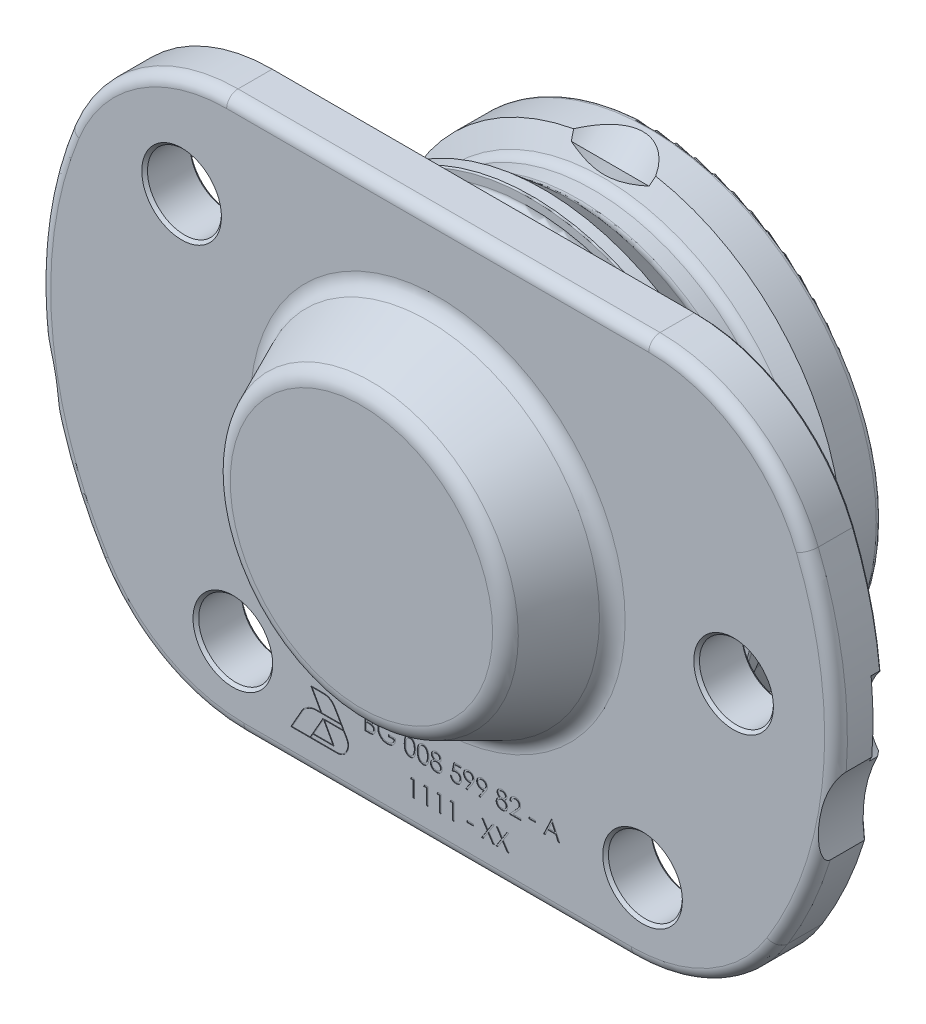
from build123d import *

# Parameters (mm, degrees)
SKETCH1_R          = 6.5
EXTRUDE1_DEPTH     = 8.5
FILLET5_R          = 0.8
FILLET1_R          = 2
CIRPATTERN1_COUNT  = 3
SKETCH11_R         = 10
CUT_EXTRUDE1_DEPTH = 2
SKETCH13_R         = 23.25
CUT_EXTRUDE2_DEPTH = 92.526826688
CHAMFER3_SIZE      = 0.5
SKETCH8_W          = 1.153846153
SKETCH8_H          = 0.307692308
SKETCH8_W_2        = 1.153846154
ENGRAVE_PN_DEPTH   = 0.1


with BuildPart() as part:
    # Sketch1 → Extrude1 (new body)
    with BuildSketch(Plane.XY):
        with BuildLine():
            Line((37.080992464, 45), (-37.080992464, 45))
            ThreePointArc((-37.080992464, 45), (-53.851502298, 39.874685925), (-64.891736793, 26.249999993))
            ThreePointArc((-64.891736793, 26.249999993), (-69.752249506, -5.884190048), (-59.577155894, -36.74999999))
            ThreePointArc((-59.577155894, -36.74999999), (-48.664280614, -47.196373792), (-34.044089092, -51))
            Line((-34.044089092, -51), (34.044089092, -51))
            ThreePointArc((34.044089092, -51), (48.664280614, -47.196373792), (59.577155894, -36.74999999))
            ThreePointArc((59.577155894, -36.74999999), (69.752249506, -5.884190048), (64.891736793, 26.249999993))
            ThreePointArc((64.891736793, 26.249999993), (53.851502298, 39.874685925), (37.080992464, 45))
        make_face()
        with Locations((52, 0)):
            Circle(SKETCH1_R, mode=Mode.SUBTRACT)
        with Locations((36, -37.523326079)):
            Circle(SKETCH1_R, mode=Mode.SUBTRACT)
        with Locations((-36, -37.523326079)):
            Circle(SKETCH1_R, mode=Mode.SUBTRACT)
        with Locations((-45, 26.057628442)):
            Circle(SKETCH1_R, mode=Mode.SUBTRACT)
    extrude(amount=EXTRUDE1_DEPTH)

    # Sketch2 → Revolve1 (revolve)
    with BuildSketch(Plane(origin=(0, 0, 0), x_dir=(0, 0, -1), z_dir=(1, 0, 0))):
        with BuildLine():
            Line((0, 39.975), (3.85, 39.975))
            ThreePointArc((3.85, 39.975), (4.026776695, 39.901776695), (4.1, 39.725))
            Line((4.1, 39.725), (4.1, 38.35))
            ThreePointArc((4.1, 38.35), (4.334314575, 37.784314575), (4.9, 37.55))
            Line((4.9, 37.55), (7, 37.55))
            ThreePointArc((7, 37.55), (7.565685425, 37.784314575), (7.8, 38.35))
            Line((7.8, 38.35), (7.8, 39.725))
            ThreePointArc((7.8, 39.725), (7.873223305, 39.901776695), (8.05, 39.975))
            Line((8.05, 39.975), (10.1, 39.975))
            Line((10.1, 39.975), (14.875462576, 35.967911114))
            ThreePointArc((14.875462576, 35.967911114), (15.476997509, 35.620614758), (16.161037795, 35.5))
            Line((16.161037795, 35.5), (18.861657007, 35.5))
            ThreePointArc((18.861657007, 35.5), (19.861657007, 35.767949192), (20.593707815, 36.5))
            Line((20.593707815, 36.5), (22.6, 39.975))
            Line((22.6, 39.975), (28.6, 39.975))
            ThreePointArc((28.6, 39.975), (29.307106781, 39.682106781), (29.6, 38.975))
            Line((29.6, 38.975), (29.6, 0))
            Line((29.6, 0), (-21.9, 0))
            Line((-21.9, 0), (-21.9, 23.056277226))
            ThreePointArc((-21.9, 23.056277226), (-21.417735353, 24.687537074), (-20.125994206, 25.794330953))
            Line((-20.125994206, 25.794330953), (-10.274005794, 30.205669047))
            ThreePointArc((-10.274005794, 30.205669047), (-8.982264647, 31.312462926), (-8.5, 32.943722774))
            Line((-8.5, 32.943722774), (-8.5, 39.975))
            Line((-8.5, 39.975), (0, 39.975))
        make_face()
    revolve(axis=Axis((0, 0, 0), (0, 0, -1)))

    # Fillet5
    fillet5_edges = [part.edges().sort_by_distance(p)[0] for p in [
        (0, -39.975, 0),
    ]]
    fillet(fillet5_edges, radius=FILLET5_R)

    # Sketch3 → Cut-Revolve1 (revolve, cut)
    with BuildSketch(Plane(origin=(0, 0, 0), x_dir=(0, 0, -1), z_dir=(1, 0, 0))):
        with BuildLine():
            Line((29.6, 32), (26.892893219, 29.292893219))
            ThreePointArc((26.892893219, 29.292893219), (26.56846987, 29.076120467), (26.185786438, 29))
            Line((26.185786438, 29), (-1.32820323, 29))
            ThreePointArc((-1.32820323, 29), (-2.363479411, 28.863703305), (-3.32820323, 28.464101615))
            Line((-3.32820323, 28.464101615), (-12.4, 23.226497308))
            ThreePointArc((-12.4, 23.226497308), (-13.864101615, 21.762395693), (-14.4, 19.762395693))
            Line((-14.4, 19.762395693), (-14.4, 0))
            Line((-14.4, 0), (29.6, 0))
            Line((29.6, 0), (29.6, 32))
        make_face()
    revolve(axis=Axis((0, 0, 0), (0, 0, -1)), mode=Mode.SUBTRACT)

    # Fillet1
    fillet1_edges = [part.edges().sort_by_distance(p)[0] for p in [
        (53.851502298, 39.874685925, 8.5),
        (69.752249506, -5.884190048, 8.5),
        (48.664280614, -47.196373792, 8.5),
        (0, -51, 8.5),
        (-48.664280614, -47.196373792, 8.5),
        (-69.752249506, -5.884190048, 8.5),
        (-53.851502298, 39.874685925, 8.5),
        (0, 45, 8.5),
    ]]
    fillet(fillet1_edges, radius=FILLET1_R)

    # Sketch9 → Cut-Revolve3 (revolve, cut)
    with BuildSketch(Plane(origin=(0, 0, 0), x_dir=(0, 0, -1), z_dir=(1, 0, 0))):
        Polygon((15.515111108, -36.099276358), (12.301173059, -32.269054143), (10.572767753, -32.54280665), (3.623893754, -24.261461096), (2.85784931, -24.904248706), (13.6, -37.706245382), (18.654949073, -43.7304991), (20.57006018, -42.123530076), align=None)
    cut_revolve3 = revolve(axis=Axis((0, -37.706245382, -13.6), (0, 0.766044443118974, 0.6427876096865442)), mode=Mode.SUBTRACT)

    # CirPattern1: Cut-Revolve3 ×3 about axis
    cirpattern1_axis = Axis((0, 0, -26.185786438), (0, 0, 1))
    for i in range(1, CIRPATTERN1_COUNT):
        add(cut_revolve3.rotate(cirpattern1_axis, i * 360 / CIRPATTERN1_COUNT), mode=Mode.SUBTRACT)

    # Sketch11 → Cut-Extrude1 (cut)
    with BuildSketch(Plane(origin=(0, 0, 0), x_dir=(-1, 0, 0), z_dir=(0, 0, -1))):
        with Locations((77, 0)):
            Circle(SKETCH11_R)
        with Locations((-77, 0)):
            Circle(SKETCH11_R)
    extrude(amount=-CUT_EXTRUDE1_DEPTH, mode=Mode.SUBTRACT)

    # Sketch13 → Cut-Extrude2 (cut, through all)
    with BuildSketch(Plane(origin=(0, 0, 0), x_dir=(-1, 0, 0), z_dir=(0, 0, -1))):
        with Locations((-90, -17)):
            Circle(SKETCH13_R)
        with Locations((90, -17)):
            Circle(SKETCH13_R)
    extrude(amount=-CUT_EXTRUDE2_DEPTH, mode=Mode.SUBTRACT)

    # Chamfer3
    chamfer3_edges = [part.edges().sort_by_distance(p)[0] for p in [
        (-42.5, -37.523326079, 8.5),
        (45.5, 0, 8.5),
        (29.5, -37.523326079, 8.5),
        (-51.5, 26.057628442, 8.5),
        (-42.5, -37.523326079, 0),
        (45.5, 0, 0),
        (-48.664280614, -47.196373792, 0),
        (0, -51, 0),
        (48.664280614, -47.196373792, 0),
        (63.813654307, -28.771818289, 0),
        (67.979425232, 16.697237759, 0),
        (53.851502298, 39.874685925, 0),
        (0, 45, 0),
        (-53.851502298, 39.874685925, 0),
        (29.5, -37.523326079, 0),
        (-51.5, 26.057628442, 0),
        (-63.813654307, -28.771818289, 0),
        (67.0670859, -13.17325845, 0),
        (-67.0670859, -13.17325845, 0),
    ]]
    chamfer(chamfer3_edges, length=CHAMFER3_SIZE)

    # Sketch8 → ENGRAVE PN (cut)
    # profile 1 of 20: a face of its own
    with BuildSketch(Plane.XY.offset(8.5)):
        with BuildLine():
            Line((-12.762782706, -36.513132092), (-12.177446168, -36.513132092))
            add(Edge.make_bspline(
                [(-12.177446168, -36.513132092), (-12.148793186, -36.513282735), (-12.093256577, -36.513574719), (-12.012497056, -36.518103117), (-11.936855218, -36.524277691), (-11.866309128, -36.534074913), (-11.800891383, -36.545896437), (-11.740404837, -36.560212279), (-11.685041832, -36.577377948), (-11.618945201, -36.60467476), (-11.543584634, -36.645237476), (-11.461986012, -36.705176246), (-11.392210949, -36.778489786), (-11.332051249, -36.861189205), (-11.284221718, -36.952162724), (-11.249619463, -37.049242028), (-11.227712713, -37.15117495), (-11.225459769, -37.221154817), (-11.224321168, -37.256521515)],
                knots=[0, 0, 0, 0, 1.001505555, 1.941167018, 2.826882275, 3.653841531, 4.429895133, 5.150066043, 5.825578002, 6.45369114, 7.647487171, 8.808567382, 9.977351308, 11.170798116, 12.373658725, 13.556498008, 14.765093433, 16, 16, 16, 16], degree=3))
            add(Edge.make_bspline(
                [(-11.224321168, -37.256521515), (-11.225258212, -37.289652277), (-11.227099593, -37.354757348), (-11.244707672, -37.449980871), (-11.272273959, -37.540624773), (-11.310592744, -37.626358246), (-11.360394455, -37.7052442), (-11.419415871, -37.777918999), (-11.490624559, -37.84130562), (-11.543975908, -37.876742393), (-11.571075975, -37.894742669)],
                knots=[0, 0, 0, 0, 1.044552857, 2.05264487, 3.044412934, 4.028983338, 5.005914585, 5.980388656, 6.974128949, 8, 8, 8, 8], degree=3))
            add(Edge.make_bspline(
                [(-11.571075975, -37.894742669), (-11.536995609, -37.907826953), (-11.471791425, -37.932860431), (-11.382060558, -37.977119401), (-11.30475069, -38.025258352), (-11.239267422, -38.07782851), (-11.183263718, -38.134493205), (-11.134361197, -38.196083302), (-11.092634305, -38.263402238), (-11.05688037, -38.335748125), (-11.028981437, -38.412382241), (-11.008087804, -38.492585763), (-10.996115705, -38.576071096), (-10.994412012, -38.632887136), (-10.993551937, -38.661569592)],
                knots=[0, 0, 0, 0, 1.27268992, 2.434971085, 3.483601985, 4.442670788, 5.356604649, 6.2567628, 7.179492994, 8.113709626, 9.066344395, 10.018646069, 10.999752585, 12, 12, 12, 12], degree=3))
            add(Edge.make_bspline(
                [(-10.993551937, -38.661569592), (-10.994389233, -38.690855482), (-10.996036638, -38.748476292), (-11.0081909, -38.83312355), (-11.028770134, -38.914016361), (-11.057116831, -38.991677947), (-11.094113101, -39.065958062), (-11.13913707, -39.13694086), (-11.192821267, -39.203913143), (-11.252875155, -39.267619106), (-11.320814137, -39.324900066), (-11.394113355, -39.375913529), (-11.473695915, -39.417867297), (-11.558254767, -39.453109601), (-11.648738467, -39.480030056), (-11.744740702, -39.498863691), (-11.846178675, -39.511553723), (-11.915787033, -39.512597041), (-11.951484629, -39.513132092)],
                knots=[0, 0, 0, 0, 0.978564426, 1.925352924, 2.850884081, 3.763762016, 4.682927383, 5.618979971, 6.567305752, 7.547517671, 8.540179244, 9.531824382, 10.526200242, 11.540722885, 12.589160233, 13.674978461, 14.80764778, 16, 16, 16, 16], degree=3))
            Line((-11.951484629, -39.513132092), (-12.762782706, -39.513132092))
            Line((-12.762782706, -39.513132092), (-12.762782706, -36.513132092))
        make_face()
        with BuildLine():
            Line((-12.493551937, -36.820824399), (-12.493551937, -37.782362861))
            Line((-12.493551937, -37.782362861), (-12.312662514, -37.782362861))
            add(Edge.make_bspline(
                [(-12.312662514, -37.782362861), (-12.286220689, -37.78202007), (-12.235129696, -37.781357727), (-12.161141213, -37.779460427), (-12.092462626, -37.774147818), (-12.029212483, -37.768836737), (-11.971490388, -37.760201376), (-11.919424221, -37.749922413), (-11.872196852, -37.739051352), (-11.817734385, -37.72056322), (-11.755957572, -37.693239499), (-11.690100626, -37.650835068), (-11.632042509, -37.600328479), (-11.583016348, -37.542050512), (-11.54289223, -37.477879495), (-11.515023332, -37.408839312), (-11.496125659, -37.336650628), (-11.494418632, -37.287092125), (-11.493551937, -37.261930169)],
                knots=[0, 0, 0, 0, 1.156816544, 2.235205308, 3.236616184, 4.169592532, 5.011045266, 5.787822928, 6.49130361, 7.128639758, 8.301311294, 9.436451833, 10.541879658, 11.654887649, 12.756523258, 13.837046038, 14.901820046, 16, 16, 16, 16], degree=3))
            add(Edge.make_bspline(
                [(-11.493551937, -37.261930169), (-11.494002948, -37.245279507), (-11.494887657, -37.212617417), (-11.502133345, -37.165003685), (-11.514448409, -37.120223325), (-11.530266374, -37.077662659), (-11.552370965, -37.038652502), (-11.57839679, -37.001844049), (-11.609841668, -36.968490804), (-11.64563365, -36.937316949), (-11.686783898, -36.909678782), (-11.733267863, -36.885472413), (-11.785714443, -36.865980319), (-11.843239747, -36.848909331), (-11.906729251, -36.836919365), (-11.975450297, -36.826930747), (-12.04996577, -36.82184554), (-12.101518715, -36.821172372), (-12.128167321, -36.820824399)],
                knots=[0, 0, 0, 0, 0.91205012, 1.789085906, 2.630437955, 3.453916878, 4.269457761, 5.079663411, 5.91843418, 6.774407191, 7.675494373, 8.627863946, 9.638891023, 10.736472738, 11.911756761, 13.175263542, 14.539845004, 16, 16, 16, 16], degree=3))
            Line((-12.128167321, -36.820824399), (-12.493551937, -36.820824399))
        make_face(mode=Mode.SUBTRACT)
        with BuildLine():
            Line((-12.493551937, -38.090055169), (-12.493551937, -39.205439784))
            Line((-12.493551937, -39.205439784), (-12.110138475, -39.205439784))
            add(Edge.make_bspline(
                [(-12.110138475, -39.205439784), (-12.082693682, -39.205110858), (-12.02979746, -39.204476895), (-11.953424977, -39.202407277), (-11.88263946, -39.197699612), (-11.817763915, -39.190288884), (-11.758097812, -39.182250213), (-11.704356924, -39.171440544), (-11.656105615, -39.159055721), (-11.600156209, -39.139912144), (-11.537153202, -39.110172312), (-11.469258182, -39.065331547), (-11.408892852, -39.011911569), (-11.357631201, -38.950085071), (-11.315620068, -38.882858219), (-11.28505825, -38.811590776), (-11.266208944, -38.737460324), (-11.263927084, -38.686917428), (-11.262782706, -38.661569592)],
                knots=[0, 0, 0, 0, 1.160039823, 2.235823828, 3.228722157, 4.157150951, 4.99529583, 5.772374946, 6.472645482, 7.099169577, 8.269452708, 9.405989375, 10.527446681, 11.663510218, 12.788923519, 13.866172445, 14.929861265, 16, 16, 16, 16], degree=3))
            add(Edge.make_bspline(
                [(-11.262782706, -38.661569592), (-11.263019367, -38.645718157), (-11.263488871, -38.614270972), (-11.270569398, -38.568057413), (-11.280867001, -38.523292379), (-11.294179659, -38.479854316), (-11.313567773, -38.438528564), (-11.336201955, -38.398497799), (-11.362740299, -38.359709103), (-11.404092441, -38.310670028), (-11.464239857, -38.254169731), (-11.549702807, -38.198851872), (-11.646879062, -38.154239466), (-11.717359771, -38.135297058), (-11.753768283, -38.125511899)],
                knots=[0, 0, 0, 0, 0.723448775, 1.435228256, 2.130040452, 2.821711965, 3.505591119, 4.210454504, 4.921174351, 5.648778258, 7.137944449, 8.670945889, 10.280296675, 12, 12, 12, 12], degree=3))
            add(Edge.make_bspline(
                [(-11.753768283, -38.125511899), (-11.768364651, -38.122550399), (-11.800012587, -38.116129255), (-11.851619085, -38.109351223), (-11.910535544, -38.103312601), (-11.97689801, -38.098845894), (-12.050790445, -38.094228857), (-12.132370661, -38.092433296), (-12.221305502, -38.090291073), (-12.28301325, -38.090135815), (-12.31506636, -38.090055169)],
                knots=[0, 0, 0, 0, 0.634451884, 1.375622551, 2.216452059, 3.157844607, 4.20941857, 5.370758133, 6.634282058, 8, 8, 8, 8], degree=3))
            Line((-12.31506636, -38.090055169), (-12.493551937, -38.090055169))
        make_face(mode=Mode.SUBTRACT)
    # profile 2 of 20: a face of its own
    with BuildSketch(Plane.XY.offset(8.5)):
        with BuildLine():
            Line((-7.570475014, -37.025151322), (-7.801244245, -37.243901322))
            add(Edge.make_bspline(
                [(-7.801244245, -37.243901322), (-7.843003292, -37.204617726), (-7.925525617, -37.126987272), (-8.060062968, -37.026263561), (-8.200431797, -36.939978333), (-8.345899652, -36.869772987), (-8.492864126, -36.813756335), (-8.639374506, -36.773875072), (-8.783927964, -36.748441469), (-8.880071294, -36.745400009), (-8.927446168, -36.743901322)],
                knots=[0, 0, 0, 0, 1.08915593, 2.152340314, 3.188132944, 4.216796309, 5.218260357, 6.173443236, 7.099959455, 8, 8, 8, 8], degree=3))
            add(Edge.make_bspline(
                [(-8.927446168, -36.743901322), (-8.95651591, -36.744255842), (-9.014580002, -36.744963961), (-9.100827383, -36.75400186), (-9.186170215, -36.767000315), (-9.270447393, -36.785807638), (-9.353822781, -36.809643975), (-9.436006403, -36.839460086), (-9.517151565, -36.874221724), (-9.59649392, -36.914389559), (-9.673414351, -36.958515142), (-9.746063068, -37.007413891), (-9.814903124, -37.059518568), (-9.878640631, -37.116133693), (-9.93764222, -37.176746435), (-9.993312253, -37.240229269), (-10.043692792, -37.308316599), (-10.089199505, -37.379755707), (-10.129795178, -37.453291869), (-10.165631167, -37.528217289), (-10.195714385, -37.60428345), (-10.219516775, -37.681585802), (-10.239154479, -37.759526308), (-10.25296957, -37.838644639), (-10.26075819, -37.919025513), (-10.262105429, -37.972851734), (-10.262782706, -37.999910938)],
                knots=[0, 0, 0, 0, 1.02818874, 2.053710826, 3.065248034, 4.081641283, 5.106893873, 6.131558223, 7.173050175, 8.228653731, 9.27666206, 10.308777013, 11.325269123, 12.329503258, 13.32196095, 14.316845687, 15.314881793, 16.315733098, 17.311955233, 18.285320748, 19.252783886, 20.203351036, 21.145449891, 22.095197417, 23.042428769, 24, 24, 24, 24], degree=3))
            add(Edge.make_bspline(
                [(-10.262782706, -37.999910938), (-10.262134948, -38.027571638), (-10.260841199, -38.082817507), (-10.252560925, -38.165269569), (-10.237193862, -38.246497057), (-10.216650112, -38.326766885), (-10.19095227, -38.406216526), (-10.158918556, -38.484501535), (-10.120976613, -38.561619013), (-10.077059568, -38.636874113), (-10.028899965, -38.710179562), (-9.974948753, -38.779230581), (-9.917639681, -38.844946675), (-9.85488491, -38.905868759), (-9.788696731, -38.963626384), (-9.717097637, -39.01662826), (-9.641495528, -39.065895308), (-9.561775061, -39.110806611), (-9.478801247, -39.150928213), (-9.39372403, -39.186605838), (-9.306271617, -39.215988127), (-9.216903597, -39.239935073), (-9.125726507, -39.2595639), (-9.032277534, -39.27219174), (-8.937243784, -39.281355309), (-8.873182099, -39.282025312), (-8.840907706, -39.282362861)],
                knots=[0, 0, 0, 0, 0.93586088, 1.869166235, 2.799637598, 3.729985548, 4.670839027, 5.622275134, 6.589130586, 7.576015415, 8.568469353, 9.55398029, 10.53834874, 11.515998671, 12.510579167, 13.508179873, 14.527009472, 15.561807829, 16.601455013, 17.643573243, 18.680854198, 19.719860599, 20.772568776, 21.833555941, 22.908541556, 24, 24, 24, 24], degree=3))
            add(Edge.make_bspline(
                [(-8.840907706, -39.282362861), (-8.80201198, -39.281549795), (-8.725633902, -39.279953209), (-8.613359809, -39.26752439), (-8.505528605, -39.248112852), (-8.402443288, -39.219684941), (-8.303984127, -39.183424648), (-8.209790178, -39.139714317), (-8.120603042, -39.086877409), (-8.036154607, -39.027242666), (-7.958362734, -38.960801381), (-7.888202056, -38.889106134), (-7.826791637, -38.812504934), (-7.77321618, -38.731448949), (-7.728894477, -38.645267259), (-7.692514938, -38.554382206), (-7.664629259, -38.45875291), (-7.653182138, -38.392674368), (-7.647398091, -38.359285938)],
                knots=[0, 0, 0, 0, 1.13008108, 2.219097802, 3.278683437, 4.311054135, 5.322181354, 6.324827112, 7.324222904, 8.330512327, 9.32562643, 10.293043162, 11.24128371, 12.174520618, 13.111833804, 14.052305215, 15.015860969, 16, 16, 16, 16], degree=3))
            Line((-7.647398091, -38.359285938), (-8.647398091, -38.359285938))
            Line((-8.647398091, -38.359285938), (-8.647398091, -38.05159363))
            Line((-8.647398091, -38.05159363), (-7.378167321, -38.05159363))
            add(Edge.make_bspline(
                [(-7.378167321, -38.05159363), (-7.379629477, -38.108942906), (-7.38249118, -38.221185799), (-7.402564536, -38.384874603), (-7.43497869, -38.539478911), (-7.479258957, -38.685161544), (-7.536580626, -38.821716052), (-7.606328507, -38.94928108), (-7.689618897, -39.067032521), (-7.78348499, -39.175931667), (-7.888827811, -39.273070992), (-8.002800913, -39.35844751), (-8.125592601, -39.430364037), (-8.257086721, -39.488873177), (-8.396852807, -39.534536601), (-8.545214276, -39.566912238), (-8.701969933, -39.586309349), (-8.809401371, -39.588787675), (-8.864345206, -39.590055169)],
                knots=[0, 0, 0, 0, 1.140356446, 2.231883559, 3.274166699, 4.278491846, 5.25512956, 6.21435461, 7.1637429, 8.11826594, 9.068280886, 10.0076534, 10.945064095, 11.891975133, 12.864533718, 13.863980011, 14.907571808, 16, 16, 16, 16], degree=3))
            add(Edge.make_bspline(
                [(-8.864345206, -39.590055169), (-8.898211036, -39.58956735), (-8.965005369, -39.588605216), (-9.063654735, -39.581767489), (-9.159584125, -39.571241281), (-9.252779561, -39.555345461), (-9.343583854, -39.535875757), (-9.431543498, -39.510944284), (-9.516993563, -39.482085399), (-9.600066122, -39.449260536), (-9.680007162, -39.411227687), (-9.757172748, -39.368962282), (-9.831989427, -39.322682259), (-9.903947569, -39.271587248), (-9.973422101, -39.216059425), (-10.039965053, -39.155987494), (-10.103948949, -39.091555106), (-10.144029346, -39.045801669), (-10.164225014, -39.022747476)],
                knots=[0, 0, 0, 0, 1.107784379, 2.184907829, 3.233506516, 4.263428166, 5.276301166, 6.270063455, 7.25232949, 8.225834625, 9.190232166, 10.146266622, 11.1027726, 12.066435141, 13.031522626, 14.010570082, 14.99756817, 16, 16, 16, 16], degree=3))
            add(Edge.make_bspline(
                [(-10.164225014, -39.022747476), (-10.193527241, -38.986172631), (-10.251645309, -38.913630045), (-10.326455158, -38.797401521), (-10.390227789, -38.677057069), (-10.441971636, -38.552261674), (-10.48237571, -38.423132063), (-10.511352498, -38.289833241), (-10.528330175, -38.152193558), (-10.530776064, -38.059051903), (-10.532013475, -38.011930169)],
                knots=[0, 0, 0, 0, 1.023165419, 2.029347347, 3.013907458, 3.994755782, 4.975994455, 5.96558838, 6.970761222, 8, 8, 8, 8], degree=3))
            add(Edge.make_bspline(
                [(-10.532013475, -38.011930169), (-10.531557271, -37.976644809), (-10.530650661, -37.906522546), (-10.519657361, -37.802416282), (-10.503884717, -37.700158546), (-10.480701528, -37.599832926), (-10.451476158, -37.501372419), (-10.415001741, -37.404731307), (-10.372534688, -37.30985256), (-10.323175691, -37.217389245), (-10.268246154, -37.128568319), (-10.20863168, -37.043747345), (-10.143485737, -36.964471004), (-10.073872194, -36.889735305), (-9.998960488, -36.820479151), (-9.919452411, -36.756061341), (-9.835286689, -36.696395468), (-9.746198534, -36.642421324), (-9.653517662, -36.593938221), (-9.557466232, -36.551433182), (-9.458073566, -36.516304626), (-9.356084299, -36.486498529), (-9.250726441, -36.46445698), (-9.142764553, -36.448472341), (-9.031635885, -36.437534684), (-8.956519289, -36.436655036), (-8.918431745, -36.436209015)],
                knots=[0, 0, 0, 0, 1.008945113, 2.00506715, 2.99143336, 3.967273523, 4.948097931, 5.927297278, 6.919902385, 7.919676788, 8.923139349, 9.905703106, 10.883022732, 11.856032218, 12.825136022, 13.798837087, 14.781400844, 15.773989409, 16.776158564, 17.77167057, 18.775803737, 19.789618931, 20.80898985, 21.851988756, 22.910860228, 24, 24, 24, 24], degree=3))
            add(Edge.make_bspline(
                [(-8.918431745, -36.436209015), (-8.887370393, -36.436705722), (-8.825779383, -36.437690634), (-8.734128755, -36.444517475), (-8.643894742, -36.455337945), (-8.554943551, -36.470103762), (-8.467578094, -36.490215496), (-8.38154949, -36.514282598), (-8.29673303, -36.54230416), (-8.213394531, -36.575723171), (-8.130973631, -36.613654849), (-8.049012054, -36.656352069), (-7.967789843, -36.70454493), (-7.887166144, -36.758376532), (-7.806632552, -36.816922318), (-7.727462858, -36.881856739), (-7.647746049, -36.950619101), (-7.596487351, -37.000060973), (-7.570475014, -37.025151322)],
                knots=[0, 0, 0, 0, 0.985871117, 1.954866573, 2.915460327, 3.869826059, 4.81536089, 5.759505086, 6.70452669, 7.649098992, 8.607881297, 9.583363685, 10.581137262, 11.603961102, 12.659522466, 13.73993555, 14.853081303, 16, 16, 16, 16], degree=3))
        make_face()
    # profile 3 of 20: a face of its own
    with BuildSketch(Plane.XY.offset(8.5)):
        with BuildLine():
            add(Edge.make_bspline(
                [(-5.878167321, -38.014334015), (-5.877886163, -37.966250539), (-5.877340009, -37.872847696), (-5.871264219, -37.736746574), (-5.861171069, -37.609066326), (-5.847339035, -37.489800841), (-5.83050648, -37.378919329), (-5.808036063, -37.276718108), (-5.782482233, -37.18272416), (-5.75286585, -37.096630975), (-5.719447746, -37.017278659), (-5.683075522, -36.943199915), (-5.642305698, -36.87450683), (-5.599468344, -36.810103009), (-5.552829426, -36.7510427), (-5.503716177, -36.696491846), (-5.450211712, -36.647711203), (-5.394134847, -36.603271515), (-5.334977878, -36.564314825), (-5.274427021, -36.530001049), (-5.212065502, -36.500686877), (-5.147723059, -36.477637932), (-5.08197801, -36.458600063), (-5.014600524, -36.445580965), (-4.945479355, -36.43738933), (-4.898823839, -36.436606186), (-4.875162514, -36.436209015)],
                knots=[0, 0, 0, 0, 1.646270934, 3.197905019, 4.663502075, 6.030701355, 7.308322542, 8.50163776, 9.611534131, 10.641858119, 11.616356847, 12.558055219, 13.465016945, 14.349605745, 15.204443733, 16.039544428, 16.859896111, 17.680448484, 18.487036065, 19.28249412, 20.06191084, 20.843045899, 21.620316918, 22.403196591, 23.190181807, 24, 24, 24, 24], degree=3))
            add(Edge.make_bspline(
                [(-4.875162514, -36.436209015), (-4.851303532, -36.436627142), (-4.803855525, -36.437458666), (-4.733706632, -36.445450616), (-4.665178333, -36.458711579), (-4.598562785, -36.477500986), (-4.533312797, -36.500811566), (-4.469938733, -36.530029095), (-4.408046949, -36.564039552), (-4.348620988, -36.604002876), (-4.291008461, -36.648559113), (-4.236624493, -36.698927114), (-4.185464133, -36.754598302), (-4.1368853, -36.814977043), (-4.092266217, -36.881221401), (-4.049774703, -36.95217921), (-4.01174153, -37.02909138), (-3.975111808, -37.110674638), (-3.943494391, -37.199186345), (-3.914980467, -37.294127569), (-3.891941351, -37.396619729), (-3.872750546, -37.506125082), (-3.857883492, -37.623045782), (-3.847055513, -37.747131195), (-3.841335726, -37.878462958), (-3.840258554, -37.968255401), (-3.839705783, -38.014334015)],
                knots=[0, 0, 0, 0, 0.810914788, 1.612654377, 2.396697861, 3.181598691, 3.963628158, 4.749916497, 5.551656086, 6.361998678, 7.18212741, 8.025565596, 8.878627764, 9.750805457, 10.657531673, 11.591944965, 12.560506719, 13.57287815, 14.630710178, 15.753379473, 16.941251878, 18.199788006, 19.531962791, 20.947069417, 22.433333509, 24, 24, 24, 24], degree=3))
            add(Edge.make_bspline(
                [(-3.839705783, -38.014334015), (-3.840264284, -38.06021165), (-3.841352501, -38.149602352), (-3.846991392, -38.280343188), (-3.85809879, -38.403770082), (-3.871993066, -38.52017905), (-3.891236748, -38.62908558), (-3.91489832, -38.730866536), (-3.941170025, -38.825961455), (-3.973599848, -38.913591293), (-4.009094743, -38.994978484), (-4.047713483, -39.070978897), (-4.089087619, -39.142264291), (-4.134163686, -39.208264074), (-4.182209469, -39.26944578), (-4.234253288, -39.324729456), (-4.288828075, -39.375447175), (-4.346610146, -39.420577142), (-4.406962904, -39.460078403), (-4.468642113, -39.49540456), (-4.532742156, -39.523889727), (-4.597810401, -39.548348334), (-4.664777572, -39.567034436), (-4.733560193, -39.579954883), (-4.803808395, -39.589016468), (-4.851295451, -39.589707736), (-4.875162514, -39.590055169)],
                knots=[0, 0, 0, 0, 1.561518951, 3.042555995, 4.452378317, 5.7783523, 7.031515105, 8.214008947, 9.334062868, 10.386615937, 11.391082383, 12.354592575, 13.286541444, 14.194233754, 15.072674879, 15.931287219, 16.775624067, 17.606195743, 18.42308326, 19.229000347, 20.022332153, 20.807536673, 21.593273796, 22.3848459, 23.188221202, 24, 24, 24, 24], degree=3))
            add(Edge.make_bspline(
                [(-4.875162514, -39.590055169), (-4.898823183, -39.589655435), (-4.945477404, -39.588867239), (-5.014608055, -39.580712612), (-5.081707292, -39.567602181), (-5.147106224, -39.549245092), (-5.21114038, -39.526775232), (-5.272937197, -39.497500646), (-5.333183783, -39.46378573), (-5.391719402, -39.425389654), (-5.447444112, -39.38139964), (-5.500671488, -39.332744536), (-5.550064361, -39.278210183), (-5.596036443, -39.218657678), (-5.639728519, -39.154634898), (-5.67991941, -39.085267722), (-5.717094428, -39.010831198), (-5.751074563, -38.930844418), (-5.781201989, -38.844140194), (-5.80781431, -38.749726612), (-5.828826445, -38.646770353), (-5.846811835, -38.536098324), (-5.861318449, -38.417234955), (-5.871222157, -38.290115716), (-5.877343284, -38.154819823), (-5.87788763, -38.062017159), (-5.878167321, -38.014334015)],
                knots=[0, 0, 0, 0, 0.810891512, 1.598919785, 2.382837074, 3.152667961, 3.926044502, 4.706494248, 5.493654104, 6.291793342, 7.103789334, 7.925228297, 8.761435821, 9.622817696, 10.50288917, 11.416980706, 12.369136599, 13.353924996, 14.394355917, 15.514179734, 16.714354668, 17.994756427, 19.357759367, 20.818452758, 22.365282078, 24, 24, 24, 24], degree=3))
        make_face()
        with BuildLine():
            add(Edge.make_bspline(
                [(-5.608936552, -38.013132092), (-5.608834169, -38.053202405), (-5.608635463, -38.130971015), (-5.603444434, -38.243979524), (-5.596372807, -38.349382663), (-5.587251695, -38.447314266), (-5.573706311, -38.537442848), (-5.558529064, -38.620388291), (-5.540059273, -38.695711637), (-5.5182064, -38.76392976), (-5.493315746, -38.82620039), (-5.466139291, -38.884144289), (-5.436944386, -38.938445949), (-5.404270828, -38.988617613), (-5.368686488, -39.034822897), (-5.330995123, -39.07787961), (-5.289790051, -39.116277023), (-5.232786843, -39.162328613), (-5.157532722, -39.209916441), (-5.062715189, -39.251355947), (-4.965285088, -39.277398053), (-4.899155446, -39.280709843), (-4.866148091, -39.282362861)],
                knots=[0, 0, 0, 0, 1.459021318, 2.831673884, 4.118529203, 5.306027144, 6.411944654, 7.436330062, 8.375795394, 9.233974572, 10.042671642, 10.816086306, 11.563610507, 12.285937304, 12.993564865, 13.685989202, 14.367179055, 15.041617293, 16.353048772, 17.594441528, 18.799311195, 20, 20, 20, 20], degree=3))
            add(Edge.make_bspline(
                [(-4.866148091, -39.282362861), (-4.832927229, -39.280993334), (-4.766554095, -39.278257109), (-4.669582271, -39.251858191), (-4.575442039, -39.212027158), (-4.50166609, -39.164929296), (-4.445538196, -39.120076442), (-4.405323633, -39.081835315), (-4.368413306, -39.039016), (-4.333405813, -38.992816604), (-4.301298034, -38.942354474), (-4.272101059, -38.887872267), (-4.245458189, -38.829218686), (-4.230279007, -38.788273195), (-4.222518283, -38.767338822)],
                knots=[0, 0, 0, 0, 1.353760809, 2.704726607, 4.075137775, 5.516104923, 6.260822281, 7.007110065, 7.778089737, 8.566572457, 9.372053459, 10.217411131, 11.088608312, 12, 12, 12, 12], degree=3))
            add(Edge.make_bspline(
                [(-4.222518283, -38.767338822), (-4.213473911, -38.740570474), (-4.195109956, -38.686219248), (-4.171442721, -38.601907546), (-4.152803807, -38.513448034), (-4.136035208, -38.421369363), (-4.124589732, -38.324992476), (-4.11537732, -38.224615575), (-4.109951017, -38.120162979), (-4.109278373, -38.049195844), (-4.108936552, -38.013132092)],
                knots=[0, 0, 0, 0, 0.884706709, 1.796334032, 2.740027952, 3.714592787, 4.726048262, 5.777819803, 6.87074269, 8, 8, 8, 8], degree=3))
            add(Edge.make_bspline(
                [(-4.108936552, -38.013132092), (-4.109408143, -37.977074172), (-4.110330675, -37.906537174), (-4.113856951, -37.803235876), (-4.122962872, -37.705120653), (-4.133076402, -37.611768819), (-4.147988306, -37.523697131), (-4.164066426, -37.440168298), (-4.185667465, -37.362217134), (-4.208741558, -37.288623206), (-4.235150468, -37.220222645), (-4.264221098, -37.156696543), (-4.29526832, -37.097738207), (-4.32899024, -37.0435094), (-4.36498654, -36.993767221), (-4.404207296, -36.949508997), (-4.445096759, -36.909363024), (-4.502368632, -36.863537965), (-4.577346595, -36.816813654), (-4.670642864, -36.773814432), (-4.767731988, -36.749121609), (-4.833366377, -36.745640163), (-4.866148091, -36.743901322)],
                knots=[0, 0, 0, 0, 1.31362396, 2.569729283, 3.763502607, 4.902122613, 5.988968491, 7.01645872, 7.998833611, 8.933434873, 9.825090667, 10.667526885, 11.477055099, 12.250526234, 12.991942729, 13.710640831, 14.402115721, 15.076753259, 16.378508321, 17.609869233, 18.806226677, 20, 20, 20, 20], degree=3))
            add(Edge.make_bspline(
                [(-4.866148091, -36.743901322), (-4.899328598, -36.745642562), (-4.96575006, -36.749128214), (-5.063848307, -36.773722432), (-5.157880608, -36.816590688), (-5.232660301, -36.863692722), (-5.289972118, -36.908554132), (-5.330328712, -36.947456807), (-5.368168289, -36.990010739), (-5.403026317, -37.036640952), (-5.435674274, -37.086754124), (-5.465657999, -37.140744493), (-5.492672853, -37.198885663), (-5.517602456, -37.261128322), (-5.539521988, -37.32934056), (-5.557602528, -37.404571126), (-5.574305717, -37.487252747), (-5.586130233, -37.577869468), (-5.596642024, -37.6758256), (-5.603397465, -37.781491873), (-5.608652828, -37.894689913), (-5.608840083, -37.97286062), (-5.608936552, -38.013132092)],
                knots=[0, 0, 0, 0, 1.207732386, 2.417664972, 3.655092373, 4.956220595, 5.625982001, 6.301752483, 6.994047911, 7.697131622, 8.419323945, 9.170223765, 9.943494443, 10.752040957, 11.610060368, 12.549350801, 13.567764191, 14.679664412, 15.874934091, 17.154273443, 18.533957287, 20, 20, 20, 20], degree=3))
        make_face(mode=Mode.SUBTRACT)
    # profile 4 of 20: a face of its own
    with BuildSketch(Plane.XY.offset(8.5)):
        with BuildLine():
            add(Edge.make_bspline(
                [(-3.570475014, -38.014334015), (-3.570193855, -37.966250539), (-3.569647701, -37.872847696), (-3.563571912, -37.736746574), (-3.553478761, -37.609066326), (-3.539646727, -37.489800841), (-3.522814173, -37.378919329), (-3.500343756, -37.276718108), (-3.474789925, -37.18272416), (-3.445173543, -37.096630975), (-3.411755438, -37.017278659), (-3.375383214, -36.943199915), (-3.334613391, -36.87450683), (-3.291776037, -36.810103009), (-3.245137118, -36.7510427), (-3.196023869, -36.696491846), (-3.142519404, -36.647711203), (-3.08644254, -36.603271515), (-3.02728557, -36.564314825), (-2.966734713, -36.530001049), (-2.904373194, -36.500686877), (-2.840030752, -36.477637932), (-2.774285702, -36.458600063), (-2.706908216, -36.445580965), (-2.637787047, -36.43738933), (-2.591131532, -36.436606186), (-2.567470206, -36.436209015)],
                knots=[0, 0, 0, 0, 1.646270934, 3.197905019, 4.663502075, 6.030701355, 7.308322542, 8.50163776, 9.611534131, 10.641858119, 11.616356847, 12.558055219, 13.465016945, 14.349605745, 15.204443733, 16.039544428, 16.859896111, 17.680448484, 18.487036065, 19.28249412, 20.06191084, 20.843045899, 21.620316918, 22.403196591, 23.190181807, 24, 24, 24, 24], degree=3))
            add(Edge.make_bspline(
                [(-2.567470206, -36.436209015), (-2.543611225, -36.436627142), (-2.496163217, -36.437458666), (-2.426014324, -36.445450616), (-2.357486025, -36.458711579), (-2.290870478, -36.477500986), (-2.225620489, -36.500811566), (-2.162246426, -36.530029095), (-2.100354641, -36.564039552), (-2.040928681, -36.604002876), (-1.983316153, -36.648559113), (-1.928932185, -36.698927114), (-1.877771826, -36.754598302), (-1.829192992, -36.814977043), (-1.784573909, -36.881221401), (-1.742082396, -36.95217921), (-1.704049222, -37.02909138), (-1.667419501, -37.110674638), (-1.635802083, -37.199186345), (-1.607288159, -37.294127569), (-1.584249043, -37.396619729), (-1.565058238, -37.506125082), (-1.550191184, -37.623045782), (-1.539363205, -37.747131195), (-1.533643418, -37.878462958), (-1.532566246, -37.968255401), (-1.532013475, -38.014334015)],
                knots=[0, 0, 0, 0, 0.810914788, 1.612654377, 2.396697861, 3.181598691, 3.963628158, 4.749916497, 5.551656086, 6.361998678, 7.18212741, 8.025565596, 8.878627764, 9.750805457, 10.657531673, 11.591944965, 12.560506719, 13.57287815, 14.630710178, 15.753379473, 16.941251878, 18.199788006, 19.531962791, 20.947069417, 22.433333509, 24, 24, 24, 24], degree=3))
            add(Edge.make_bspline(
                [(-1.532013475, -38.014334015), (-1.532571976, -38.06021165), (-1.533660193, -38.149602352), (-1.539299084, -38.280343188), (-1.550406483, -38.403770082), (-1.564300758, -38.52017905), (-1.583544441, -38.62908558), (-1.607206012, -38.730866536), (-1.633477717, -38.825961455), (-1.665907541, -38.913591293), (-1.701402435, -38.994978484), (-1.740021175, -39.070978897), (-1.781395311, -39.142264291), (-1.826471379, -39.208264074), (-1.874517161, -39.26944578), (-1.92656098, -39.324729456), (-1.981135768, -39.375447175), (-2.038917838, -39.420577142), (-2.099270596, -39.460078403), (-2.160949805, -39.49540456), (-2.225049848, -39.523889727), (-2.290118093, -39.548348334), (-2.357085264, -39.567034436), (-2.425867885, -39.579954883), (-2.496116087, -39.589016468), (-2.543603143, -39.589707736), (-2.567470206, -39.590055169)],
                knots=[0, 0, 0, 0, 1.561518951, 3.042555995, 4.452378317, 5.7783523, 7.031515105, 8.214008947, 9.334062868, 10.386615937, 11.391082383, 12.354592575, 13.286541444, 14.194233754, 15.072674879, 15.931287219, 16.775624067, 17.606195743, 18.42308326, 19.229000347, 20.022332153, 20.807536673, 21.593273796, 22.3848459, 23.188221202, 24, 24, 24, 24], degree=3))
            add(Edge.make_bspline(
                [(-2.567470206, -39.590055169), (-2.591130875, -39.589655435), (-2.637785096, -39.588867239), (-2.706915747, -39.580712612), (-2.774014984, -39.567602181), (-2.839413916, -39.549245092), (-2.903448072, -39.526775232), (-2.965244889, -39.497500646), (-3.025491475, -39.46378573), (-3.084027094, -39.425389654), (-3.139751804, -39.38139964), (-3.19297918, -39.332744536), (-3.242372053, -39.278210183), (-3.288344135, -39.218657678), (-3.332036211, -39.154634898), (-3.372227102, -39.085267722), (-3.40940212, -39.010831198), (-3.443382255, -38.930844418), (-3.473509681, -38.844140194), (-3.500122002, -38.749726612), (-3.521134137, -38.646770353), (-3.539119527, -38.536098324), (-3.553626141, -38.417234955), (-3.563529849, -38.290115716), (-3.569650976, -38.154819823), (-3.570195322, -38.062017159), (-3.570475014, -38.014334015)],
                knots=[0, 0, 0, 0, 0.810891512, 1.598919785, 2.382837074, 3.152667961, 3.926044502, 4.706494248, 5.493654104, 6.291793342, 7.103789334, 7.925228297, 8.761435821, 9.622817696, 10.50288917, 11.416980706, 12.369136599, 13.353924996, 14.394355917, 15.514179734, 16.714354668, 17.994756427, 19.357759367, 20.818452758, 22.365282078, 24, 24, 24, 24], degree=3))
        make_face()
        with BuildLine():
            add(Edge.make_bspline(
                [(-3.301244245, -38.013132092), (-3.301141861, -38.053202405), (-3.300943156, -38.130971015), (-3.295752127, -38.243979524), (-3.288680499, -38.349382663), (-3.279559387, -38.447314266), (-3.266014003, -38.537442848), (-3.250836756, -38.620388291), (-3.232366965, -38.695711637), (-3.210514093, -38.76392976), (-3.185623438, -38.82620039), (-3.158446984, -38.884144289), (-3.129252078, -38.938445949), (-3.096578521, -38.988617613), (-3.060994181, -39.034822897), (-3.023302816, -39.07787961), (-2.982097743, -39.116277023), (-2.925094536, -39.162328613), (-2.849840415, -39.209916441), (-2.755022882, -39.251355947), (-2.657592781, -39.277398053), (-2.591463138, -39.280709843), (-2.558455783, -39.282362861)],
                knots=[0, 0, 0, 0, 1.459021318, 2.831673884, 4.118529203, 5.306027144, 6.411944654, 7.436330062, 8.375795394, 9.233974572, 10.042671642, 10.816086306, 11.563610507, 12.285937304, 12.993564865, 13.685989202, 14.367179055, 15.041617293, 16.353048772, 17.594441528, 18.799311195, 20, 20, 20, 20], degree=3))
            add(Edge.make_bspline(
                [(-2.558455783, -39.282362861), (-2.525234922, -39.280993334), (-2.458861787, -39.278257109), (-2.361889963, -39.251858191), (-2.267749732, -39.212027158), (-2.193973783, -39.164929296), (-2.137845888, -39.120076442), (-2.097631325, -39.081835315), (-2.060720998, -39.039016), (-2.025713505, -38.992816604), (-1.993605726, -38.942354474), (-1.964408751, -38.887872267), (-1.937765882, -38.829218686), (-1.9225867, -38.788273195), (-1.914825975, -38.767338822)],
                knots=[0, 0, 0, 0, 1.353760809, 2.704726607, 4.075137775, 5.516104923, 6.260822281, 7.007110065, 7.778089737, 8.566572457, 9.372053459, 10.217411131, 11.088608312, 12, 12, 12, 12], degree=3))
            add(Edge.make_bspline(
                [(-1.914825975, -38.767338822), (-1.905781603, -38.740570474), (-1.887417648, -38.686219248), (-1.863750413, -38.601907546), (-1.8451115, -38.513448034), (-1.8283429, -38.421369363), (-1.816897424, -38.324992476), (-1.807685012, -38.224615575), (-1.802258709, -38.120162979), (-1.801586066, -38.049195844), (-1.801244245, -38.013132092)],
                knots=[0, 0, 0, 0, 0.884706709, 1.796334032, 2.740027952, 3.714592787, 4.726048262, 5.777819803, 6.87074269, 8, 8, 8, 8], degree=3))
            add(Edge.make_bspline(
                [(-1.801244245, -38.013132092), (-1.801715835, -37.977074172), (-1.802638368, -37.906537174), (-1.806164643, -37.803235876), (-1.815270564, -37.705120653), (-1.825384094, -37.611768819), (-1.840295998, -37.523697131), (-1.856374118, -37.440168298), (-1.877975157, -37.362217134), (-1.90104925, -37.288623206), (-1.927458161, -37.220222645), (-1.95652879, -37.156696543), (-1.987576012, -37.097738207), (-2.021297932, -37.0435094), (-2.057294232, -36.993767221), (-2.096514988, -36.949508997), (-2.137404451, -36.909363024), (-2.194676324, -36.863537965), (-2.269654287, -36.816813654), (-2.362950556, -36.773814432), (-2.46003968, -36.749121609), (-2.525674069, -36.745640163), (-2.558455783, -36.743901322)],
                knots=[0, 0, 0, 0, 1.31362396, 2.569729283, 3.763502607, 4.902122613, 5.988968491, 7.01645872, 7.998833611, 8.933434873, 9.825090667, 10.667526885, 11.477055099, 12.250526234, 12.991942729, 13.710640831, 14.402115721, 15.076753259, 16.378508321, 17.609869233, 18.806226677, 20, 20, 20, 20], degree=3))
            add(Edge.make_bspline(
                [(-2.558455783, -36.743901322), (-2.591636291, -36.745642562), (-2.658057752, -36.749128214), (-2.756155999, -36.773722432), (-2.850188301, -36.816590688), (-2.924967993, -36.863692722), (-2.98227981, -36.908554132), (-3.022636405, -36.947456807), (-3.060475981, -36.990010739), (-3.09533401, -37.036640952), (-3.127981967, -37.086754124), (-3.157965692, -37.140744493), (-3.184980546, -37.198885663), (-3.209910148, -37.261128322), (-3.231829681, -37.32934056), (-3.249910221, -37.404571126), (-3.266613409, -37.487252747), (-3.278437925, -37.577869468), (-3.288949716, -37.6758256), (-3.295705157, -37.781491873), (-3.300960521, -37.894689913), (-3.301147776, -37.97286062), (-3.301244245, -38.013132092)],
                knots=[0, 0, 0, 0, 1.207732386, 2.417664972, 3.655092373, 4.956220595, 5.625982001, 6.301752483, 6.994047911, 7.697131622, 8.419323945, 9.170223765, 9.943494443, 10.752040957, 11.610060368, 12.549350801, 13.567764191, 14.679664412, 15.874934091, 17.154273443, 18.533957287, 20, 20, 20, 20], degree=3))
        make_face(mode=Mode.SUBTRACT)
    # profile 5 of 20: a face of its own
    with BuildSketch(Plane.XY.offset(8.5)):
        with BuildLine():
            add(Edge.make_bspline(
                [(0.195750948, -37.841858053), (0.220306845, -37.854662015), (0.268199046, -37.879634018), (0.336408082, -37.919843299), (0.398743797, -37.962221269), (0.456935707, -38.004766291), (0.509961437, -38.049107706), (0.557228076, -38.09542184), (0.599903179, -38.142552651), (0.637126137, -38.191298228), (0.669866283, -38.24152907), (0.698162398, -38.293377018), (0.722348572, -38.346728447), (0.741516806, -38.40216573), (0.757306913, -38.458874526), (0.768171717, -38.517587082), (0.774014789, -38.577916517), (0.775119487, -38.618689347), (0.775678832, -38.639334015)],
                knots=[0, 0, 0, 0, 1.272397273, 2.481599622, 3.635517121, 4.734568067, 5.792894095, 6.808321871, 7.773003508, 8.711915296, 9.623354172, 10.525449501, 11.423591555, 12.311487226, 13.218079475, 14.126165749, 15.051214107, 16, 16, 16, 16], degree=3))
            add(Edge.make_bspline(
                [(0.775678832, -38.639334015), (0.775017615, -38.668217786), (0.773708817, -38.725389606), (0.762308831, -38.809771987), (0.745240563, -38.891724943), (0.720315267, -38.971230506), (0.687989504, -39.047849969), (0.648152216, -39.121648918), (0.603056897, -39.193836897), (0.566840692, -39.238253527), (0.548515371, -39.260728245)],
                knots=[0, 0, 0, 0, 1.025265484, 2.029385089, 3.018602448, 3.995076438, 4.983346944, 5.966715145, 6.97116228, 8, 8, 8, 8], degree=3))
            add(Edge.make_bspline(
                [(0.548515371, -39.260728245), (0.524655536, -39.28695148), (0.477230708, -39.339073903), (0.395988199, -39.406746026), (0.306826584, -39.463616935), (0.21009087, -39.509964273), (0.106039641, -39.546037866), (-0.005304935, -39.571960025), (-0.124159923, -39.586807821), (-0.205850327, -39.588954098), (-0.247758668, -39.590055169)],
                knots=[0, 0, 0, 0, 0.954267603, 1.896743057, 2.838368354, 3.796610408, 4.779680527, 5.799409237, 6.871065594, 8, 8, 8, 8], degree=3))
            add(Edge.make_bspline(
                [(-0.247758668, -39.590055169), (-0.288055858, -39.58906733), (-0.366470097, -39.587145097), (-0.480605421, -39.574121299), (-0.586996623, -39.551297413), (-0.68626231, -39.520059177), (-0.777804048, -39.479421838), (-0.861360991, -39.428843202), (-0.938138682, -39.370359109), (-1.005807088, -39.302289899), (-1.065882897, -39.229383151), (-1.118655514, -39.154167486), (-1.16251901, -39.076636036), (-1.19965652, -38.997944864), (-1.228086254, -38.916991018), (-1.24777672, -38.834191007), (-1.260281846, -38.749689456), (-1.261945676, -38.692662324), (-1.262782706, -38.663973438)],
                knots=[0, 0, 0, 0, 1.256902934, 2.445805442, 3.576955095, 4.645999104, 5.686449165, 6.692658513, 7.68621702, 8.689161843, 9.678783111, 10.630372946, 11.551080876, 12.453998257, 13.34127905, 14.221779781, 15.105423033, 16, 16, 16, 16], degree=3))
            add(Edge.make_bspline(
                [(-1.262782706, -38.663973438), (-1.26228738, -38.642922702), (-1.261308439, -38.601319017), (-1.254532855, -38.539853879), (-1.243639888, -38.48002862), (-1.228846068, -38.421622269), (-1.208796617, -38.365060035), (-1.184589074, -38.310073915), (-1.156361686, -38.25660183), (-1.123720688, -38.20435136), (-1.085747524, -38.154054636), (-1.04275011, -38.104858069), (-0.99386908, -38.05752504), (-0.939648229, -38.011477247), (-0.880707196, -37.965897841), (-0.815515027, -37.923250074), (-0.74579994, -37.880514675), (-0.696252449, -37.854964682), (-0.670835591, -37.841858053)],
                knots=[0, 0, 0, 0, 0.941657376, 1.861047343, 2.762797495, 3.66048619, 4.553285746, 5.444104102, 6.34607688, 7.256116206, 8.197091036, 9.162375105, 10.176350973, 11.237807142, 12.343728897, 13.50695164, 14.721116704, 16, 16, 16, 16], degree=3))
            add(Edge.make_bspline(
                [(-0.670835591, -37.841858053), (-0.705628198, -37.822885394), (-0.772996423, -37.786149016), (-0.862198801, -37.718651754), (-0.938819335, -37.645547913), (-1.000751951, -37.565293803), (-1.049499575, -37.480396482), (-1.082944093, -37.391387123), (-1.10556965, -37.299916168), (-1.107810931, -37.237425143), (-1.108936552, -37.206040745)],
                knots=[0, 0, 0, 0, 1.166880483, 2.259407225, 3.286803203, 4.280235371, 5.237608625, 6.161067461, 7.076446754, 8, 8, 8, 8], degree=3))
            add(Edge.make_bspline(
                [(-1.108936552, -37.206040745), (-1.10753476, -37.17407141), (-1.104716914, -37.109807469), (-1.08193121, -37.014145078), (-1.044799725, -36.920188022), (-0.994296013, -36.828391697), (-0.931392685, -36.741862942), (-0.855924217, -36.664256416), (-0.76969282, -36.596275146), (-0.673128934, -36.539209855), (-0.56921216, -36.492766719), (-0.459570111, -36.46072807), (-0.346113117, -36.439782828), (-0.2688865, -36.437411409), (-0.229729821, -36.436209015)],
                knots=[0, 0, 0, 0, 0.888701115, 1.786444228, 2.72001202, 3.692817113, 4.693886446, 5.687152267, 6.695133018, 7.739871481, 8.800368666, 9.853104506, 10.91144658, 12, 12, 12, 12], degree=3))
            add(Edge.make_bspline(
                [(-0.229729821, -36.436209015), (-0.191583694, -36.437448737), (-0.116363877, -36.439893329), (-0.005797054, -36.460282082), (0.099995698, -36.494335956), (0.200649555, -36.540533576), (0.294362584, -36.597436668), (0.377164563, -36.666351703), (0.450306776, -36.743615889), (0.510807686, -36.830118406), (0.560661591, -36.921562001), (0.595376649, -37.017238447), (0.617621198, -37.115080498), (0.620426939, -37.181284501), (0.621832679, -37.214454207)],
                knots=[0, 0, 0, 0, 1.072916533, 2.115669174, 3.151510826, 4.193348718, 5.225979165, 6.227137561, 7.216255879, 8.211077061, 9.189680878, 10.138522389, 11.067357538, 12, 12, 12, 12], degree=3))
            add(Edge.make_bspline(
                [(0.621832679, -37.214454207), (0.620603055, -37.247005633), (0.618188145, -37.310934784), (0.597873911, -37.404128944), (0.563662499, -37.491404978), (0.516953217, -37.573753223), (0.456074227, -37.64968022), (0.38183817, -37.72015148), (0.294836903, -37.785745905), (0.229470429, -37.822762788), (0.195750948, -37.841858053)],
                knots=[0, 0, 0, 0, 0.975232327, 1.915300861, 2.843280834, 3.77672583, 4.742871857, 5.749627742, 6.839139064, 8, 8, 8, 8], degree=3))
        make_face()
        with BuildLine():
            add(Edge.make_bspline(
                [(-0.24475386, -36.743901322), (-0.265797408, -36.7444597), (-0.306967789, -36.745552131), (-0.367335221, -36.751259534), (-0.424740107, -36.762362291), (-0.479782222, -36.77713833), (-0.531706919, -36.797099462), (-0.581219394, -36.820580899), (-0.627476985, -36.849128955), (-0.671038102, -36.881152839), (-0.710253052, -36.91637533), (-0.745056953, -36.953072803), (-0.773966765, -36.991965996), (-0.798516288, -37.032087447), (-0.816329017, -37.074627941), (-0.829669849, -37.118283235), (-0.838688184, -37.163604993), (-0.839363947, -37.194579145), (-0.839705783, -37.210247476)],
                knots=[0, 0, 0, 0, 1.203892937, 2.355340988, 3.463153438, 4.544400666, 5.610487187, 6.640501085, 7.674077295, 8.714426146, 9.728707835, 10.68524104, 11.601827946, 12.495867327, 13.368432065, 14.231010473, 15.105153427, 16, 16, 16, 16], degree=3))
            add(Edge.make_bspline(
                [(-0.839705783, -37.210247476), (-0.839116611, -37.225916484), (-0.837952324, -37.256880695), (-0.828947928, -37.302605723), (-0.815527767, -37.347538555), (-0.794398629, -37.390610764), (-0.769056036, -37.433316501), (-0.737777628, -37.474588432), (-0.700501318, -37.51457019), (-0.658477798, -37.552921711), (-0.61269648, -37.588834937), (-0.564195871, -37.620011949), (-0.513584679, -37.64609833), (-0.461382905, -37.667809248), (-0.407058521, -37.684686337), (-0.350944401, -37.696659463), (-0.293031114, -37.704101174), (-0.253790616, -37.70499005), (-0.233936552, -37.705439784)],
                knots=[0, 0, 0, 0, 0.873023192, 1.725219244, 2.590779336, 3.480155217, 4.391973325, 5.357036234, 6.360879153, 7.436073238, 8.526419356, 9.601555421, 10.645666583, 11.697338044, 12.750135903, 13.812665442, 14.89329948, 16, 16, 16, 16], degree=3))
            add(Edge.make_bspline(
                [(-0.233936552, -37.705439784), (-0.208436463, -37.704691612), (-0.157688148, -37.703202658), (-0.082877293, -37.689358795), (-0.010137883, -37.667582294), (0.059752606, -37.637788037), (0.124985108, -37.600392729), (0.183133738, -37.55562157), (0.233702503, -37.504508344), (0.276165884, -37.447848771), (0.309088609, -37.387547409), (0.33471873, -37.327032873), (0.349685486, -37.265659532), (0.351637686, -37.224544991), (0.352601909, -37.204237861)],
                knots=[0, 0, 0, 0, 1.076279235, 2.141928126, 3.20205304, 4.278698113, 5.344010996, 6.36967002, 7.368914609, 8.37248503, 9.349703398, 10.264243087, 11.142681841, 12, 12, 12, 12], degree=3))
            add(Edge.make_bspline(
                [(0.352601909, -37.204237861), (0.352145997, -37.189985259), (0.351241077, -37.161695886), (0.343783886, -37.119920144), (0.331461743, -37.079094787), (0.314779103, -37.038882555), (0.292827851, -36.999847642), (0.266801404, -36.961376424), (0.235186117, -36.92433434), (0.19970346, -36.887858156), (0.159464538, -36.854100421), (0.114546899, -36.824413527), (0.065180827, -36.799202935), (0.011365156, -36.77872686), (-0.046701922, -36.763347703), (-0.108752957, -36.751830834), (-0.17530534, -36.745339595), (-0.22110227, -36.744391145), (-0.24475386, -36.743901322)],
                knots=[0, 0, 0, 0, 0.814439003, 1.616544685, 2.417341072, 3.248991801, 4.09997495, 4.973547432, 5.9003056, 6.880240646, 7.880314356, 8.896779544, 9.951930927, 11.043077905, 12.18215768, 13.381699519, 14.647792085, 16, 16, 16, 16], degree=3))
        make_face(mode=Mode.SUBTRACT)
        with BuildLine():
            add(Edge.make_bspline(
                [(-0.227325975, -38.013132092), (-0.25400522, -38.013606641), (-0.306343388, -38.014537592), (-0.383020755, -38.024900021), (-0.456609183, -38.039325215), (-0.526860557, -38.061208791), (-0.593745212, -38.089662926), (-0.657625225, -38.123892531), (-0.718011908, -38.16435434), (-0.774071387, -38.210534296), (-0.825262813, -38.260299542), (-0.870175641, -38.312981372), (-0.908316373, -38.367600686), (-0.939030588, -38.424851168), (-0.964240644, -38.483520549), (-0.980795396, -38.545069916), (-0.991408292, -38.608316013), (-0.992833404, -38.651310383), (-0.993551937, -38.672987861)],
                knots=[0, 0, 0, 0, 1.140299081, 2.23698856, 3.303958914, 4.344563908, 5.37730929, 6.408454204, 7.439741482, 8.480804886, 9.510774543, 10.48932336, 11.43758569, 12.353841022, 13.263987381, 14.161954604, 15.073269652, 16, 16, 16, 16], degree=3))
            add(Edge.make_bspline(
                [(-0.993551937, -38.672987861), (-0.992383429, -38.699928638), (-0.990065138, -38.753378509), (-0.971673733, -38.832375427), (-0.94215756, -38.908850617), (-0.900993089, -38.982180862), (-0.850020884, -39.050709525), (-0.787341054, -39.110442761), (-0.716848908, -39.163518314), (-0.636159318, -39.206444486), (-0.548020633, -39.24072579), (-0.452456294, -39.264345187), (-0.350837792, -39.279980715), (-0.280672428, -39.281556299), (-0.24475386, -39.282362861)],
                knots=[0, 0, 0, 0, 0.898778495, 1.783155532, 2.693654817, 3.627872908, 4.583023416, 5.533784346, 6.509005473, 7.520592997, 8.575161974, 9.658835044, 10.801527049, 12, 12, 12, 12], degree=3))
            add(Edge.make_bspline(
                [(-0.24475386, -39.282362861), (-0.216682116, -39.281823882), (-0.161989357, -39.280773779), (-0.082201401, -39.271504384), (-0.006906073, -39.256804706), (0.063750611, -39.235424523), (0.130559617, -39.209324544), (0.192388206, -39.175748474), (0.250826943, -39.137560768), (0.302996191, -39.092253777), (0.35051037, -39.043842781), (0.391938907, -38.992594173), (0.427902522, -38.939900774), (0.456129055, -38.884571787), (0.478694416, -38.827668717), (0.494914606, -38.768666851), (0.50492279, -38.707385222), (0.505934986, -38.66581459), (0.506448063, -38.644742669)],
                knots=[0, 0, 0, 0, 1.224942928, 2.386581632, 3.501229538, 4.569074225, 5.605009692, 6.626002462, 7.634866581, 8.645888296, 9.63523824, 10.59253846, 11.518950513, 12.414518923, 13.29783783, 14.186679152, 15.080837789, 16, 16, 16, 16], degree=3))
            add(Edge.make_bspline(
                [(0.506448063, -38.644742669), (0.505671622, -38.624276377), (0.504140614, -38.583920424), (0.49442345, -38.524120544), (0.477352698, -38.466346703), (0.453929215, -38.409903841), (0.422745533, -38.355935598), (0.386021359, -38.303036022), (0.341712114, -38.252673355), (0.291644175, -38.204456416), (0.237079351, -38.159871499), (0.179078941, -38.120430551), (0.118089403, -38.087214452), (0.054239793, -38.060200313), (-0.012328112, -38.03895391), (-0.081565351, -38.024111629), (-0.153552986, -38.014769112), (-0.202457161, -38.01368393), (-0.227325975, -38.013132092)],
                knots=[0, 0, 0, 0, 0.917430815, 1.809013306, 2.70690318, 3.612392954, 4.541220862, 5.495268465, 6.494511384, 7.542276156, 8.608045339, 9.649016899, 10.681629292, 11.715607085, 12.752076957, 13.808767841, 14.885711793, 16, 16, 16, 16], degree=3))
        make_face(mode=Mode.SUBTRACT)
    # profile 6 of 20: a face of its own
    with BuildSketch(Plane.XY.offset(8.5)):
        with BuildLine():
            Line((4.08337114, -36.513132092), (4.08337114, -36.820824399))
            Line((4.08337114, -36.820824399), (3.063539409, -36.820824399))
            Line((3.063539409, -36.820824399), (2.901279794, -37.609886899))
            add(Edge.make_bspline(
                [(2.901279794, -37.609886899), (2.933041972, -37.601118095), (2.994576168, -37.584129923), (3.085398906, -37.565267834), (3.171620795, -37.553897454), (3.227571113, -37.552344902), (3.254645179, -37.55159363)],
                knots=[0, 0, 0, 0, 1.100273476, 2.13160584, 3.095893838, 4, 4, 4, 4], degree=3))
            add(Edge.make_bspline(
                [(3.254645179, -37.55159363), (3.288145527, -37.552318718), (3.354015582, -37.553744421), (3.450391822, -37.567434578), (3.542391445, -37.588983076), (3.629822048, -37.619086381), (3.712845377, -37.657580438), (3.790697572, -37.705666101), (3.864547212, -37.761837528), (3.933069435, -37.826418966), (3.995233128, -37.897494638), (4.049889691, -37.97391567), (4.096314768, -38.054939381), (4.133652558, -38.141339902), (4.163467702, -38.232162034), (4.183312269, -38.32836139), (4.196526591, -38.429031208), (4.198002922, -38.497863696), (4.198755755, -38.532963822)],
                knots=[0, 0, 0, 0, 1.052922333, 2.070308379, 3.05430497, 4.020497103, 4.973039431, 5.925935799, 6.892292201, 7.88610001, 8.88166317, 9.857072816, 10.836096531, 11.812156883, 12.81219415, 13.836441305, 14.89672472, 16, 16, 16, 16], degree=3))
            add(Edge.make_bspline(
                [(4.198755755, -38.532963822), (4.198185691, -38.55741144), (4.197053266, -38.605976286), (4.191294476, -38.678099887), (4.18020672, -38.748696601), (4.165320099, -38.817775794), (4.145998027, -38.885206684), (4.122607409, -38.95118228), (4.093982242, -39.015291943), (4.062583921, -39.078142281), (4.027229797, -39.13831243), (3.987991076, -39.19458299), (3.946534941, -39.247798089), (3.901928039, -39.297387003), (3.853755758, -39.343023875), (3.8026015, -39.384979545), (3.748873455, -39.423963542), (3.691740391, -39.458393424), (3.632475405, -39.490075958), (3.570222648, -39.516067561), (3.50639919, -39.539305157), (3.44008644, -39.557827609), (3.3714346, -39.572341227), (3.300330507, -39.582198885), (3.227147075, -39.589378688), (3.177539922, -39.589828137), (3.152481717, -39.590055169)],
                knots=[0, 0, 0, 0, 1.056347294, 2.098418968, 3.122841568, 4.141288669, 5.149314143, 6.15115421, 7.162517403, 8.180376062, 9.185164535, 10.17417709, 11.141909838, 12.097768115, 13.052685741, 14.0056014, 14.954263652, 15.917497458, 16.885230207, 17.854509472, 18.828990115, 19.81800267, 20.826176721, 21.857883937, 22.917946725, 24, 24, 24, 24], degree=3))
            add(Edge.make_bspline(
                [(3.152481717, -39.590055169), (3.122589562, -39.589463022), (3.063780279, -39.588298043), (2.977619793, -39.57611077), (2.894721559, -39.558655984), (2.815752901, -39.532396324), (2.740006104, -39.499492929), (2.668500917, -39.457907639), (2.599410252, -39.410782693), (2.535542792, -39.355170962), (2.476266123, -39.294386092), (2.423203401, -39.228422399), (2.37594605, -39.158368592), (2.335250838, -39.08388446), (2.300538248, -39.005165719), (2.273268258, -38.921917432), (2.25125824, -38.834574572), (2.241946736, -38.774442991), (2.237217294, -38.743901322)],
                knots=[0, 0, 0, 0, 1.0467383, 2.05933395, 3.04377827, 4.011590433, 4.970194871, 5.932262533, 6.905835911, 7.896367577, 8.894135286, 9.877477877, 10.858688626, 11.851381753, 12.8477658, 13.868841284, 14.917554742, 16, 16, 16, 16], degree=3))
            Line((2.237217294, -38.743901322), (2.506448063, -38.743901322))
            add(Edge.make_bspline(
                [(2.506448063, -38.743901322), (2.513072541, -38.77250971), (2.525805155, -38.82749662), (2.55375294, -38.904752056), (2.58792369, -38.973597104), (2.628555989, -39.034942461), (2.677027443, -39.088435888), (2.732338382, -39.136107655), (2.794350717, -39.179114909), (2.863259199, -39.214962995), (2.935956124, -39.245536212), (3.012042304, -39.265894808), (3.08944603, -39.280209859), (3.141798919, -39.281642797), (3.168106717, -39.282362861)],
                knots=[0, 0, 0, 0, 1.136247022, 2.183929868, 3.172523383, 4.106158343, 5.02341133, 5.958108904, 6.928429099, 7.938127109, 8.96079061, 9.975095812, 10.982467395, 12, 12, 12, 12], degree=3))
            add(Edge.make_bspline(
                [(3.168106717, -39.282362861), (3.193785384, -39.281659337), (3.244346888, -39.280274093), (3.318756648, -39.269612082), (3.390596255, -39.253191307), (3.459156846, -39.228617145), (3.525638166, -39.198750244), (3.588358541, -39.160423036), (3.649132435, -39.116314449), (3.706070835, -39.065780194), (3.758218935, -39.010091885), (3.80429561, -38.950539833), (3.842675822, -38.887011108), (3.875019344, -38.820605548), (3.899579314, -38.750595356), (3.917100155, -38.677308635), (3.927388491, -38.600564366), (3.928803788, -38.548219243), (3.929524986, -38.521545553)],
                knots=[0, 0, 0, 0, 1.027316725, 2.022795036, 3.002884548, 3.971462791, 4.93288096, 5.914575861, 6.907176829, 7.935150275, 8.956128384, 9.956726525, 10.942570165, 11.921478529, 12.907843606, 13.90538589, 14.932640048, 16, 16, 16, 16], degree=3))
            add(Edge.make_bspline(
                [(3.929524986, -38.521545553), (3.928960575, -38.497480623), (3.927855821, -38.450376947), (3.918829618, -38.381463341), (3.903129356, -38.316257876), (3.881337459, -38.254445676), (3.853669309, -38.19596844), (3.819858185, -38.140765817), (3.779269558, -38.089565388), (3.732905082, -38.042343199), (3.682112475, -37.998761878), (3.626017839, -37.961609804), (3.565795044, -37.930355017), (3.502169673, -37.903382447), (3.433628332, -37.88401038), (3.361528361, -37.869466478), (3.285091183, -37.86105331), (3.232830593, -37.859885977), (3.205967294, -37.859285938)],
                knots=[0, 0, 0, 0, 1.045622112, 2.046656509, 3.013763289, 3.955457236, 4.890082067, 5.820317437, 6.762574623, 7.722996705, 8.69280354, 9.665887285, 10.63943826, 11.638615906, 12.663482002, 13.728887084, 14.832589034, 16, 16, 16, 16], degree=3))
            add(Edge.make_bspline(
                [(3.205967294, -37.859285938), (3.182713926, -37.859783587), (3.134701622, -37.860811107), (3.061053485, -37.868376676), (2.983660579, -37.880581786), (2.902819583, -37.897369998), (2.818287719, -37.919339492), (2.730243375, -37.945666207), (2.638501433, -37.977142206), (2.57668624, -38.000912675), (2.544909602, -38.013132092)],
                knots=[0, 0, 0, 0, 0.817624296, 1.688186739, 2.600797293, 3.572016777, 4.590301741, 5.671205678, 6.80286297, 8, 8, 8, 8], degree=3))
            Line((2.544909602, -38.013132092), (2.852601909, -36.513132092))
            Line((2.852601909, -36.513132092), (4.08337114, -36.513132092))
        make_face()
    # profile 7 of 20: a face of its own
    with BuildSketch(Plane.XY.offset(8.5)):
        with BuildLine():
            Line((5.160294217, -39.590055169), (4.945149986, -39.440415745))
            Line((4.945149986, -39.440415745), (5.779284602, -38.221064784))
            add(Edge.make_bspline(
                [(5.779284602, -38.221064784), (5.726063971, -38.227573124), (5.621269582, -38.240388408), (5.515723495, -38.242742684), (5.463779794, -38.243901322)],
                knots=[0, 0, 0, 0, 1.015715272, 2, 2, 2, 2], degree=3))
            add(Edge.make_bspline(
                [(5.463779794, -38.243901322), (5.43228661, -38.243094685), (5.370468244, -38.241511328), (5.279583971, -38.228961206), (5.19225349, -38.209632525), (5.108708328, -38.180790735), (5.028634467, -38.144946556), (4.952206712, -38.100497687), (4.879527949, -38.04820658), (4.81137874, -37.98834973), (4.74939725, -37.922625685), (4.69417728, -37.853063706), (4.648284882, -37.778855731), (4.610162094, -37.701515543), (4.581250277, -37.619931528), (4.560196673, -37.535032042), (4.547234655, -37.446222063), (4.545692573, -37.385771951), (4.544909602, -37.355079207)],
                knots=[0, 0, 0, 0, 1.060718605, 2.082097864, 3.085795603, 4.069760067, 5.054557537, 6.03741023, 7.043284206, 8.066802108, 9.088538119, 10.083643548, 11.053783639, 12.022749082, 12.983451788, 13.964007469, 14.966251758, 16, 16, 16, 16], degree=3))
            add(Edge.make_bspline(
                [(4.544909602, -37.355079207), (4.54639626, -37.313106076), (4.549314269, -37.230721335), (4.572798712, -37.110349533), (4.61142186, -36.996532495), (4.665274754, -36.889569472), (4.733104516, -36.790999124), (4.814626164, -36.702191745), (4.909343848, -36.624410442), (5.015099864, -36.557549804), (5.129402454, -36.503776949), (5.249118446, -36.464143263), (5.373330549, -36.44083005), (5.457474266, -36.437756455), (5.499837486, -36.436209015)],
                knots=[0, 0, 0, 0, 1.022988612, 2.007919123, 2.978103895, 3.94594894, 4.918897164, 5.887013414, 6.875921846, 7.89917871, 8.930658928, 9.948724884, 10.967259574, 12, 12, 12, 12], degree=3))
            add(Edge.make_bspline(
                [(5.499837486, -36.436209015), (5.541398989, -36.437777726), (5.6235206, -36.440877351), (5.744282606, -36.463577896), (5.859946335, -36.501837902), (5.969870609, -36.554710385), (6.071647248, -36.620985448), (6.163169372, -36.699957897), (6.242348405, -36.791676921), (6.309054589, -36.893924198), (6.362600338, -37.00378161), (6.401233723, -37.118453544), (6.425015699, -37.237115305), (6.428012551, -37.317510569), (6.429524986, -37.358084015)],
                knots=[0, 0, 0, 0, 1.026385292, 2.028040595, 3.023318987, 4.028184125, 5.03290303, 6.015178782, 7.004435299, 8.016004309, 9.023023918, 10.015172535, 10.998308025, 12, 12, 12, 12], degree=3))
            add(Edge.make_bspline(
                [(6.429524986, -37.358084015), (6.428514921, -37.389578672), (6.426466258, -37.453457707), (6.412120852, -37.550512287), (6.387760693, -37.649470483), (6.36011638, -37.733231851), (6.333431664, -37.802410522), (6.308316409, -37.857054734), (6.280448849, -37.914570102), (6.24794705, -37.974353535), (6.213007938, -38.037167136), (6.173528558, -38.102380893), (6.130409497, -38.170082315), (6.099698308, -38.215722677), (6.083972102, -38.23909363)],
                knots=[0, 0, 0, 0, 1.179839688, 2.393009684, 3.667231171, 4.993948276, 5.694988576, 6.444077775, 7.246288328, 8.089075292, 8.993003841, 9.939041771, 10.944649915, 12, 12, 12, 12], degree=3))
            Line((6.083972102, -38.23909363), (5.160294217, -39.590055169))
        make_face()
        with BuildLine():
            add(Edge.make_bspline(
                [(5.513659602, -37.936209015), (5.537517328, -37.935557257), (5.583960211, -37.934288507), (5.651997895, -37.9265663), (5.716218641, -37.912874311), (5.776793998, -37.893228844), (5.834331342, -37.869523128), (5.887916766, -37.839341425), (5.937595117, -37.803327167), (5.983699054, -37.762861439), (6.024639625, -37.717903796), (6.06110508, -37.670849133), (6.092099852, -37.621490896), (6.116582661, -37.569210957), (6.136712297, -37.515281921), (6.150613451, -37.458835331), (6.158314308, -37.400165273), (6.159627086, -37.360309281), (6.160294217, -37.340055169)],
                knots=[0, 0, 0, 0, 1.163407946, 2.26475976, 3.333800367, 4.359385343, 5.366239384, 6.363380779, 7.350133999, 8.353570782, 9.349036268, 10.310270964, 11.253520213, 12.184142, 13.120487599, 14.056272588, 15.012232024, 16, 16, 16, 16], degree=3))
            add(Edge.make_bspline(
                [(6.160294217, -37.340055169), (6.159720215, -37.319792598), (6.158589073, -37.279862718), (6.149514245, -37.221105798), (6.133549768, -37.164797289), (6.112129352, -37.110628921), (6.083912006, -37.059045745), (6.050051875, -37.00940014), (6.009824061, -36.962006888), (5.963536147, -36.917980616), (5.913620816, -36.877396703), (5.860426102, -36.841580066), (5.804390459, -36.811561898), (5.745855754, -36.786791352), (5.684700026, -36.767461259), (5.620959465, -36.753560661), (5.554311974, -36.745870585), (5.509070872, -36.744566104), (5.486015371, -36.743901322)],
                knots=[0, 0, 0, 0, 0.972161553, 1.915763587, 2.844109794, 3.775983486, 4.705125789, 5.659731448, 6.655561913, 7.682237399, 8.721216875, 9.739758359, 10.754845918, 11.767244016, 12.7857855, 13.828538656, 14.893392813, 16, 16, 16, 16], degree=3))
            add(Edge.make_bspline(
                [(5.486015371, -36.743901322), (5.463160382, -36.744567178), (5.418319083, -36.745873582), (5.352264089, -36.753546043), (5.288954517, -36.767554744), (5.227975985, -36.786782399), (5.169443019, -36.811563746), (5.113410019, -36.841581639), (5.060202862, -36.877388458), (5.010335387, -36.918012549), (4.96396574, -36.96180196), (4.924429572, -37.009607756), (4.89049195, -37.05901992), (4.862313376, -37.110635784), (4.840882647, -37.164795457), (4.824920931, -37.221106295), (4.815845361, -37.279862589), (4.814714321, -37.319792555), (4.814140371, -37.340055169)],
                knots=[0, 0, 0, 0, 1.099389452, 2.15699305, 3.192601482, 4.213358962, 5.227959689, 6.245255729, 7.266013209, 8.307253147, 9.336162325, 10.327954924, 11.284637477, 12.215801273, 13.149702402, 14.080068371, 15.025723358, 16, 16, 16, 16], degree=3))
            add(Edge.make_bspline(
                [(4.814140371, -37.340055169), (4.814659736, -37.360325053), (4.815684019, -37.400300976), (4.825564982, -37.459037884), (4.842089222, -37.51534205), (4.864220128, -37.569760942), (4.893364348, -37.621765392), (4.929127646, -37.671108845), (4.971046686, -37.718350659), (5.018561104, -37.762756841), (5.070562385, -37.803515848), (5.126102453, -37.839113319), (5.18422517, -37.869175414), (5.245135139, -37.8932966), (5.308380968, -37.912678026), (5.37453108, -37.926541065), (5.443366713, -37.934214436), (5.49000384, -37.935537776), (5.513659602, -37.936209015)],
                knots=[0, 0, 0, 0, 0.952633368, 1.87876736, 2.791047057, 3.707742249, 4.635551637, 5.587206343, 6.568248508, 7.601284464, 8.641511608, 9.671105535, 10.699146789, 11.713763218, 12.747829548, 13.806491675, 14.887386225, 16, 16, 16, 16], degree=3))
        make_face(mode=Mode.SUBTRACT)
    # profile 8 of 20: a face of its own
    with BuildSketch(Plane.XY.offset(8.5)):
        with BuildLine():
            Line((7.467986525, -39.590055169), (7.252842294, -39.440415745))
            Line((7.252842294, -39.440415745), (8.086976909, -38.221064784))
            add(Edge.make_bspline(
                [(8.086976909, -38.221064784), (8.033756279, -38.227573124), (7.92896189, -38.240388408), (7.823415803, -38.242742684), (7.771472102, -38.243901322)],
                knots=[0, 0, 0, 0, 1.015715272, 2, 2, 2, 2], degree=3))
            add(Edge.make_bspline(
                [(7.771472102, -38.243901322), (7.739978918, -38.243094685), (7.678160552, -38.241511328), (7.587276278, -38.228961206), (7.499945798, -38.209632525), (7.416400636, -38.180790735), (7.336326774, -38.144946556), (7.25989902, -38.100497687), (7.187220257, -38.04820658), (7.119071048, -37.98834973), (7.057089558, -37.922625685), (7.001869588, -37.853063706), (6.955977189, -37.778855731), (6.917854402, -37.701515543), (6.888942585, -37.619931528), (6.867888981, -37.535032042), (6.854926963, -37.446222063), (6.853384881, -37.385771951), (6.852601909, -37.355079207)],
                knots=[0, 0, 0, 0, 1.060718605, 2.082097864, 3.085795603, 4.069760067, 5.054557537, 6.03741023, 7.043284206, 8.066802108, 9.088538119, 10.083643548, 11.053783639, 12.022749082, 12.983451788, 13.964007469, 14.966251758, 16, 16, 16, 16], degree=3))
            add(Edge.make_bspline(
                [(6.852601909, -37.355079207), (6.854088568, -37.313106076), (6.857006577, -37.230721335), (6.88049102, -37.110349533), (6.919114168, -36.996532495), (6.972967062, -36.889569472), (7.040796823, -36.790999124), (7.122318472, -36.702191745), (7.217036156, -36.624410442), (7.322792172, -36.557549804), (7.437094761, -36.503776949), (7.556810754, -36.464143263), (7.681022857, -36.44083005), (7.765166574, -36.437756455), (7.807529794, -36.436209015)],
                knots=[0, 0, 0, 0, 1.022988612, 2.007919123, 2.978103895, 3.94594894, 4.918897164, 5.887013414, 6.875921846, 7.89917871, 8.930658928, 9.948724884, 10.967259574, 12, 12, 12, 12], degree=3))
            add(Edge.make_bspline(
                [(7.807529794, -36.436209015), (7.849091296, -36.437777726), (7.931212908, -36.440877351), (8.051974914, -36.463577896), (8.167638642, -36.501837902), (8.277562917, -36.554710385), (8.379339556, -36.620985448), (8.47086168, -36.699957897), (8.550040713, -36.791676921), (8.616746897, -36.893924198), (8.670292645, -37.00378161), (8.708926031, -37.118453544), (8.732708007, -37.237115305), (8.735704859, -37.317510569), (8.737217294, -37.358084015)],
                knots=[0, 0, 0, 0, 1.026385292, 2.028040595, 3.023318987, 4.028184125, 5.03290303, 6.015178782, 7.004435299, 8.016004309, 9.023023918, 10.015172535, 10.998308025, 12, 12, 12, 12], degree=3))
            add(Edge.make_bspline(
                [(8.737217294, -37.358084015), (8.736207229, -37.389578672), (8.734158565, -37.453457707), (8.719813159, -37.550512287), (8.695453, -37.649470483), (8.667808687, -37.733231851), (8.641123972, -37.802410522), (8.616008716, -37.857054734), (8.588141156, -37.914570102), (8.555639357, -37.974353535), (8.520700246, -38.037167136), (8.481220866, -38.102380893), (8.438101804, -38.170082315), (8.407390616, -38.215722677), (8.391664409, -38.23909363)],
                knots=[0, 0, 0, 0, 1.179839688, 2.393009684, 3.667231171, 4.993948276, 5.694988576, 6.444077775, 7.246288328, 8.089075292, 8.993003841, 9.939041771, 10.944649915, 12, 12, 12, 12], degree=3))
            Line((8.391664409, -38.23909363), (7.467986525, -39.590055169))
        make_face()
        with BuildLine():
            add(Edge.make_bspline(
                [(7.821351909, -37.936209015), (7.845209636, -37.935557257), (7.891652518, -37.934288507), (7.959690203, -37.9265663), (8.023910949, -37.912874311), (8.084486306, -37.893228844), (8.14202365, -37.869523128), (8.195609074, -37.839341425), (8.245287424, -37.803327167), (8.291391362, -37.762861439), (8.332331933, -37.717903796), (8.368797388, -37.670849133), (8.39979216, -37.621490896), (8.424274969, -37.569210957), (8.444404605, -37.515281921), (8.458305758, -37.458835331), (8.466006615, -37.400165273), (8.467319394, -37.360309281), (8.467986525, -37.340055169)],
                knots=[0, 0, 0, 0, 1.163407946, 2.26475976, 3.333800367, 4.359385343, 5.366239384, 6.363380779, 7.350133999, 8.353570782, 9.349036268, 10.310270964, 11.253520213, 12.184142, 13.120487599, 14.056272588, 15.012232024, 16, 16, 16, 16], degree=3))
            add(Edge.make_bspline(
                [(8.467986525, -37.340055169), (8.467412523, -37.319792598), (8.466281381, -37.279862718), (8.457206553, -37.221105798), (8.441242076, -37.164797289), (8.41982166, -37.110628921), (8.391604313, -37.059045745), (8.357744183, -37.00940014), (8.317516369, -36.962006888), (8.271228455, -36.917980616), (8.221313124, -36.877396703), (8.168118409, -36.841580066), (8.112082767, -36.811561898), (8.053548061, -36.786791352), (7.992392334, -36.767461259), (7.928651772, -36.753560661), (7.862004282, -36.745870585), (7.816763179, -36.744566104), (7.793707679, -36.743901322)],
                knots=[0, 0, 0, 0, 0.972161553, 1.915763587, 2.844109794, 3.775983486, 4.705125789, 5.659731448, 6.655561913, 7.682237399, 8.721216875, 9.739758359, 10.754845918, 11.767244016, 12.7857855, 13.828538656, 14.893392813, 16, 16, 16, 16], degree=3))
            add(Edge.make_bspline(
                [(7.793707679, -36.743901322), (7.77085269, -36.744567178), (7.726011391, -36.745873582), (7.659956397, -36.753546043), (7.596646824, -36.767554744), (7.535668293, -36.786782399), (7.477135326, -36.811563746), (7.421102327, -36.841581639), (7.36789517, -36.877388458), (7.318027695, -36.918012549), (7.271658047, -36.96180196), (7.23212188, -37.009607756), (7.198184258, -37.05901992), (7.170005684, -37.110635784), (7.148574955, -37.164795457), (7.132613239, -37.221106295), (7.123537669, -37.279862589), (7.122406629, -37.319792555), (7.121832679, -37.340055169)],
                knots=[0, 0, 0, 0, 1.099389452, 2.15699305, 3.192601482, 4.213358962, 5.227959689, 6.245255729, 7.266013209, 8.307253147, 9.336162325, 10.327954924, 11.284637477, 12.215801273, 13.149702402, 14.080068371, 15.025723358, 16, 16, 16, 16], degree=3))
            add(Edge.make_bspline(
                [(7.121832679, -37.340055169), (7.122352044, -37.360325053), (7.123376327, -37.400300976), (7.13325729, -37.459037884), (7.14978153, -37.51534205), (7.171912436, -37.569760942), (7.201056656, -37.621765392), (7.236819954, -37.671108845), (7.278738994, -37.718350659), (7.326253412, -37.762756841), (7.378254692, -37.803515848), (7.433794761, -37.839113319), (7.491917478, -37.869175414), (7.552827447, -37.8932966), (7.616073276, -37.912678026), (7.682223388, -37.926541065), (7.75105902, -37.934214436), (7.797696148, -37.935537776), (7.821351909, -37.936209015)],
                knots=[0, 0, 0, 0, 0.952633368, 1.87876736, 2.791047057, 3.707742249, 4.635551637, 5.587206343, 6.568248508, 7.601284464, 8.641511608, 9.671105535, 10.699146789, 11.713763218, 12.747829548, 13.806491675, 14.887386225, 16, 16, 16, 16], degree=3))
        make_face(mode=Mode.SUBTRACT)
    # profile 9 of 20: a face of its own
    with BuildSketch(Plane.XY.offset(8.5)):
        with BuildLine():
            add(Edge.make_bspline(
                [(11.734212486, -37.841858053), (11.758768384, -37.854662015), (11.806660585, -37.879634018), (11.87486962, -37.919843299), (11.937205336, -37.962221269), (11.995397246, -38.004766291), (12.048422975, -38.049107706), (12.095689615, -38.09542184), (12.138364718, -38.142552651), (12.175587675, -38.191298228), (12.208327821, -38.24152907), (12.236623937, -38.293377018), (12.260810111, -38.346728447), (12.279978344, -38.40216573), (12.295768451, -38.458874526), (12.306633255, -38.517587082), (12.312476328, -38.577916517), (12.313581025, -38.618689347), (12.314140371, -38.639334015)],
                knots=[0, 0, 0, 0, 1.272397273, 2.481599622, 3.635517121, 4.734568067, 5.792894095, 6.808321871, 7.773003508, 8.711915296, 9.623354172, 10.525449501, 11.423591555, 12.311487226, 13.218079475, 14.126165749, 15.051214107, 16, 16, 16, 16], degree=3))
            add(Edge.make_bspline(
                [(12.314140371, -38.639334015), (12.313479153, -38.668217786), (12.312170355, -38.725389606), (12.300770369, -38.809771987), (12.283702102, -38.891724943), (12.258776806, -38.971230506), (12.226451042, -39.047849969), (12.186613754, -39.121648918), (12.141518435, -39.193836897), (12.10530223, -39.238253527), (12.086976909, -39.260728245)],
                knots=[0, 0, 0, 0, 1.025265484, 2.029385089, 3.018602448, 3.995076438, 4.983346944, 5.966715145, 6.97116228, 8, 8, 8, 8], degree=3))
            add(Edge.make_bspline(
                [(12.086976909, -39.260728245), (12.063117074, -39.28695148), (12.015692247, -39.339073903), (11.934449737, -39.406746026), (11.845288122, -39.463616935), (11.748552409, -39.509964273), (11.644501179, -39.546037866), (11.533156604, -39.571960025), (11.414301615, -39.586807821), (11.332611212, -39.588954098), (11.290702871, -39.590055169)],
                knots=[0, 0, 0, 0, 0.954267603, 1.896743057, 2.838368354, 3.796610408, 4.779680527, 5.799409237, 6.871065594, 8, 8, 8, 8], degree=3))
            add(Edge.make_bspline(
                [(11.290702871, -39.590055169), (11.250405681, -39.58906733), (11.171991441, -39.587145097), (11.057856118, -39.574121299), (10.951464915, -39.551297413), (10.852199228, -39.520059177), (10.760657491, -39.479421838), (10.677100547, -39.428843202), (10.600322856, -39.370359109), (10.532654451, -39.302289899), (10.472578642, -39.229383151), (10.419806025, -39.154167486), (10.375942529, -39.076636036), (10.338805018, -38.997944864), (10.310375285, -38.916991018), (10.290684819, -38.834191007), (10.278179692, -38.749689456), (10.276515862, -38.692662324), (10.275678832, -38.663973438)],
                knots=[0, 0, 0, 0, 1.256902934, 2.445805442, 3.576955095, 4.645999104, 5.686449165, 6.692658513, 7.68621702, 8.689161843, 9.678783111, 10.630372946, 11.551080876, 12.453998257, 13.34127905, 14.221779781, 15.105423033, 16, 16, 16, 16], degree=3))
            add(Edge.make_bspline(
                [(10.275678832, -38.663973438), (10.276174159, -38.642922702), (10.277153099, -38.601319017), (10.283928683, -38.539853879), (10.29482165, -38.48002862), (10.30961547, -38.421622269), (10.329664922, -38.365060035), (10.353872464, -38.310073915), (10.382099852, -38.25660183), (10.414740851, -38.20435136), (10.452714014, -38.154054636), (10.495711428, -38.104858069), (10.544592459, -38.05752504), (10.598813309, -38.011477247), (10.657754343, -37.965897841), (10.722946512, -37.923250074), (10.792661598, -37.880514675), (10.842209089, -37.854964682), (10.867625948, -37.841858053)],
                knots=[0, 0, 0, 0, 0.941657376, 1.861047343, 2.762797495, 3.66048619, 4.553285746, 5.444104102, 6.34607688, 7.256116206, 8.197091036, 9.162375105, 10.176350973, 11.237807142, 12.343728897, 13.50695164, 14.721116704, 16, 16, 16, 16], degree=3))
            add(Edge.make_bspline(
                [(10.867625948, -37.841858053), (10.832833341, -37.822885394), (10.765465116, -37.786149016), (10.676262737, -37.718651754), (10.599642203, -37.645547913), (10.537709588, -37.565293803), (10.488961964, -37.480396482), (10.455517446, -37.391387123), (10.432891888, -37.299916168), (10.430650608, -37.237425143), (10.429524986, -37.206040745)],
                knots=[0, 0, 0, 0, 1.166880483, 2.259407225, 3.286803203, 4.280235371, 5.237608625, 6.161067461, 7.076446754, 8, 8, 8, 8], degree=3))
            add(Edge.make_bspline(
                [(10.429524986, -37.206040745), (10.430926778, -37.17407141), (10.433744625, -37.109807469), (10.456530328, -37.014145078), (10.493661814, -36.920188022), (10.544165526, -36.828391697), (10.607068854, -36.741862942), (10.682537321, -36.664256416), (10.768768719, -36.596275146), (10.865332605, -36.539209855), (10.969249378, -36.492766719), (11.078891427, -36.46072807), (11.192348421, -36.439782828), (11.269575038, -36.437411409), (11.308731717, -36.436209015)],
                knots=[0, 0, 0, 0, 0.888701115, 1.786444228, 2.72001202, 3.692817113, 4.693886446, 5.687152267, 6.695133018, 7.739871481, 8.800368666, 9.853104506, 10.91144658, 12, 12, 12, 12], degree=3))
            add(Edge.make_bspline(
                [(11.308731717, -36.436209015), (11.346877844, -36.437448737), (11.422097661, -36.439893329), (11.532664485, -36.460282082), (11.638457237, -36.494335956), (11.739111093, -36.540533576), (11.832824122, -36.597436668), (11.915626102, -36.666351703), (11.988768315, -36.743615889), (12.049269224, -36.830118406), (12.099123129, -36.921562001), (12.133838187, -37.017238447), (12.156082737, -37.115080498), (12.158888477, -37.181284501), (12.160294217, -37.214454207)],
                knots=[0, 0, 0, 0, 1.072916533, 2.115669174, 3.151510826, 4.193348718, 5.225979165, 6.227137561, 7.216255879, 8.211077061, 9.189680878, 10.138522389, 11.067357538, 12, 12, 12, 12], degree=3))
            add(Edge.make_bspline(
                [(12.160294217, -37.214454207), (12.159064594, -37.247005633), (12.156649683, -37.310934784), (12.136335449, -37.404128944), (12.102124038, -37.491404978), (12.055414755, -37.573753223), (11.994535766, -37.64968022), (11.920299709, -37.72015148), (11.833298442, -37.785745905), (11.767931968, -37.822762788), (11.734212486, -37.841858053)],
                knots=[0, 0, 0, 0, 0.975232327, 1.915300861, 2.843280834, 3.77672583, 4.742871857, 5.749627742, 6.839139064, 8, 8, 8, 8], degree=3))
        make_face()
        with BuildLine():
            add(Edge.make_bspline(
                [(11.293707679, -36.743901322), (11.272664131, -36.7444597), (11.23149375, -36.745552131), (11.171126317, -36.751259534), (11.113721431, -36.762362291), (11.058679316, -36.77713833), (11.00675462, -36.797099462), (10.957242145, -36.820580899), (10.910984553, -36.849128955), (10.867423437, -36.881152839), (10.828208487, -36.91637533), (10.793404586, -36.953072803), (10.764494773, -36.991965996), (10.739945251, -37.032087447), (10.722132522, -37.074627941), (10.70879169, -37.118283235), (10.699773354, -37.163604993), (10.699097591, -37.194579145), (10.698755755, -37.210247476)],
                knots=[0, 0, 0, 0, 1.203892937, 2.355340988, 3.463153438, 4.544400666, 5.610487187, 6.640501085, 7.674077295, 8.714426146, 9.728707835, 10.68524104, 11.601827946, 12.495867327, 13.368432065, 14.231010473, 15.105153427, 16, 16, 16, 16], degree=3))
            add(Edge.make_bspline(
                [(10.698755755, -37.210247476), (10.699344927, -37.225916484), (10.700509215, -37.256880695), (10.70951361, -37.302605723), (10.722933772, -37.347538555), (10.74406291, -37.390610764), (10.769405503, -37.433316501), (10.800683911, -37.474588432), (10.83796022, -37.51457019), (10.879983741, -37.552921711), (10.925765059, -37.588834937), (10.974265667, -37.620011949), (11.02487686, -37.64609833), (11.077078634, -37.667809248), (11.131403017, -37.684686337), (11.187517137, -37.696659463), (11.245430425, -37.704101174), (11.284670923, -37.70499005), (11.304524986, -37.705439784)],
                knots=[0, 0, 0, 0, 0.873023192, 1.725219244, 2.590779336, 3.480155217, 4.391973325, 5.357036234, 6.360879153, 7.436073238, 8.526419356, 9.601555421, 10.645666583, 11.697338044, 12.750135903, 13.812665442, 14.89329948, 16, 16, 16, 16], degree=3))
            add(Edge.make_bspline(
                [(11.304524986, -37.705439784), (11.330025075, -37.704691612), (11.38077339, -37.703202658), (11.455584246, -37.689358795), (11.528323655, -37.667582294), (11.598214145, -37.637788037), (11.663446647, -37.600392729), (11.721595276, -37.55562157), (11.772164042, -37.504508344), (11.814627422, -37.447848771), (11.847550147, -37.387547409), (11.873180268, -37.327032873), (11.888147024, -37.265659532), (11.890099225, -37.224544991), (11.891063448, -37.204237861)],
                knots=[0, 0, 0, 0, 1.076279235, 2.141928126, 3.20205304, 4.278698113, 5.344010996, 6.36967002, 7.368914609, 8.37248503, 9.349703398, 10.264243087, 11.142681841, 12, 12, 12, 12], degree=3))
            add(Edge.make_bspline(
                [(11.891063448, -37.204237861), (11.890607536, -37.189985259), (11.889702615, -37.161695886), (11.882245424, -37.119920144), (11.869923282, -37.079094787), (11.853240642, -37.038882555), (11.831289389, -36.999847642), (11.805262943, -36.961376424), (11.773647656, -36.92433434), (11.738164999, -36.887858156), (11.697926077, -36.854100421), (11.653008438, -36.824413527), (11.603642366, -36.799202935), (11.549826695, -36.77872686), (11.491759617, -36.763347703), (11.429708582, -36.751830834), (11.363156198, -36.745339595), (11.317359269, -36.744391145), (11.293707679, -36.743901322)],
                knots=[0, 0, 0, 0, 0.814439003, 1.616544685, 2.417341072, 3.248991801, 4.09997495, 4.973547432, 5.9003056, 6.880240646, 7.880314356, 8.896779544, 9.951930927, 11.043077905, 12.18215768, 13.381699519, 14.647792085, 16, 16, 16, 16], degree=3))
        make_face(mode=Mode.SUBTRACT)
        with BuildLine():
            add(Edge.make_bspline(
                [(11.311135563, -38.013132092), (11.284456318, -38.013606641), (11.23211815, -38.014537592), (11.155440783, -38.024900021), (11.081852355, -38.039325215), (11.011600981, -38.061208791), (10.944716327, -38.089662926), (10.880836313, -38.123892531), (10.820449631, -38.16435434), (10.764390151, -38.210534296), (10.713198726, -38.260299542), (10.668285897, -38.312981372), (10.630145165, -38.367600686), (10.59943095, -38.424851168), (10.574220894, -38.483520549), (10.557666142, -38.545069916), (10.547053247, -38.608316013), (10.545628134, -38.651310383), (10.544909602, -38.672987861)],
                knots=[0, 0, 0, 0, 1.140299081, 2.23698856, 3.303958914, 4.344563908, 5.37730929, 6.408454204, 7.439741482, 8.480804886, 9.510774543, 10.48932336, 11.43758569, 12.353841022, 13.263987381, 14.161954604, 15.073269652, 16, 16, 16, 16], degree=3))
            add(Edge.make_bspline(
                [(10.544909602, -38.672987861), (10.546078109, -38.699928638), (10.548396401, -38.753378509), (10.566787805, -38.832375427), (10.596303979, -38.908850617), (10.63746845, -38.982180862), (10.688440655, -39.050709525), (10.751120484, -39.110442761), (10.821612631, -39.163518314), (10.90230222, -39.206444486), (10.990440905, -39.24072579), (11.086005244, -39.264345187), (11.187623746, -39.279980715), (11.257789111, -39.281556299), (11.293707679, -39.282362861)],
                knots=[0, 0, 0, 0, 0.898778495, 1.783155532, 2.693654817, 3.627872908, 4.583023416, 5.533784346, 6.509005473, 7.520592997, 8.575161974, 9.658835044, 10.801527049, 12, 12, 12, 12], degree=3))
            add(Edge.make_bspline(
                [(11.293707679, -39.282362861), (11.321779422, -39.281823882), (11.376472182, -39.280773779), (11.456260138, -39.271504384), (11.531555465, -39.256804706), (11.602212149, -39.235424523), (11.669021155, -39.209324544), (11.730849744, -39.175748474), (11.789288482, -39.137560768), (11.84145773, -39.092253777), (11.888971909, -39.043842781), (11.930400445, -38.992594173), (11.96636406, -38.939900774), (11.994590594, -38.884571787), (12.017155954, -38.827668717), (12.033376144, -38.768666851), (12.043384329, -38.707385222), (12.044396525, -38.66581459), (12.044909602, -38.644742669)],
                knots=[0, 0, 0, 0, 1.224942928, 2.386581632, 3.501229538, 4.569074225, 5.605009692, 6.626002462, 7.634866581, 8.645888296, 9.63523824, 10.59253846, 11.518950513, 12.414518923, 13.29783783, 14.186679152, 15.080837789, 16, 16, 16, 16], degree=3))
            add(Edge.make_bspline(
                [(12.044909602, -38.644742669), (12.04413316, -38.624276377), (12.042602153, -38.583920424), (12.032884989, -38.524120544), (12.015814237, -38.466346703), (11.992390754, -38.409903841), (11.961207072, -38.355935598), (11.924482897, -38.303036022), (11.880173653, -38.252673355), (11.830105713, -38.204456416), (11.77554089, -38.159871499), (11.71754048, -38.120430551), (11.656550941, -38.087214452), (11.592701332, -38.060200313), (11.526133427, -38.03895391), (11.456896188, -38.024111629), (11.384908552, -38.014769112), (11.336004377, -38.01368393), (11.311135563, -38.013132092)],
                knots=[0, 0, 0, 0, 0.917430815, 1.809013306, 2.70690318, 3.612392954, 4.541220862, 5.495268465, 6.494511384, 7.542276156, 8.608045339, 9.649016899, 10.681629292, 11.715607085, 12.752076957, 13.808767841, 14.885711793, 16, 16, 16, 16], degree=3))
        make_face(mode=Mode.SUBTRACT)
    # profile 10 of 20: a face of its own
    with BuildSketch(Plane.XY.offset(8.5)):
        with BuildLine():
            Line((12.967986525, -37.436209015), (12.698755755, -37.436209015))
            add(Edge.make_bspline(
                [(12.698755755, -37.436209015), (12.700510458, -37.400491111), (12.703956647, -37.330342098), (12.720095181, -37.228064464), (12.743187361, -37.130303208), (12.775837179, -37.037843282), (12.816385417, -36.949867162), (12.865011155, -36.866724291), (12.922605884, -36.788731843), (12.987925942, -36.716612835), (13.058870489, -36.65045206), (13.135418438, -36.593318995), (13.215857032, -36.545046705), (13.299942231, -36.504691355), (13.388622714, -36.474400058), (13.481093735, -36.451924367), (13.577761567, -36.438401785), (13.643624443, -36.436948255), (13.67712114, -36.436209015)],
                knots=[0, 0, 0, 0, 1.10065271, 2.161652631, 3.183658789, 4.190468796, 5.17591951, 6.163126047, 7.15150782, 8.156236427, 9.156009102, 10.134482811, 11.092018607, 12.041330605, 13.001268258, 13.972401359, 14.968799086, 16, 16, 16, 16], degree=3))
            add(Edge.make_bspline(
                [(13.67712114, -36.436209015), (13.710016632, -36.43697912), (13.774655099, -36.43849235), (13.868993969, -36.451487518), (13.958803078, -36.471840882), (14.043906878, -36.500396953), (14.123626362, -36.538783605), (14.1985604, -36.584895781), (14.269601095, -36.638227065), (14.333549767, -36.701016048), (14.392270977, -36.768046664), (14.442930053, -36.839607724), (14.486312765, -36.91351854), (14.522473633, -36.990342713), (14.549093181, -37.070803595), (14.569303074, -37.153729768), (14.580726571, -37.239979606), (14.582479791, -37.298356654), (14.58337114, -37.328035938)],
                knots=[0, 0, 0, 0, 1.111607364, 2.184268762, 3.212621178, 4.221274766, 5.211760367, 6.196651075, 7.1921475, 8.207485113, 9.220403448, 10.201281604, 11.166441695, 12.114753415, 13.065576456, 14.026450734, 14.996634279, 16, 16, 16, 16], degree=3))
            add(Edge.make_bspline(
                [(14.58337114, -37.328035938), (14.581925444, -37.369821489), (14.579059423, -37.452659313), (14.554325964, -37.574548762), (14.516112738, -37.692753099), (14.469764427, -37.787878001), (14.422946797, -37.864143909), (14.38164983, -37.927500173), (14.332233527, -37.995065673), (14.27515003, -38.067520909), (14.211260482, -38.145087512), (14.140105053, -38.227797311), (14.061140175, -38.314771859), (14.005718876, -38.374176841), (13.977000948, -38.404959015)],
                knots=[0, 0, 0, 0, 1.184203166, 2.347625244, 3.513805382, 4.700623107, 5.337941753, 6.051866363, 6.845199593, 7.711357327, 8.668078039, 9.695487809, 10.805859518, 12, 12, 12, 12], degree=3))
            Line((13.977000948, -38.404959015), (13.226399986, -39.205439784))
            Line((13.226399986, -39.205439784), (14.621832679, -39.205439784))
            Line((14.621832679, -39.205439784), (14.621832679, -39.513132092))
            Line((14.621832679, -39.513132092), (12.58337114, -39.513132092))
            Line((12.58337114, -39.513132092), (13.746832679, -38.271545553))
            add(Edge.make_bspline(
                [(13.746832679, -38.271545553), (13.775159439, -38.241975576), (13.829569348, -38.185177702), (13.906525842, -38.102255165), (13.975644975, -38.025326987), (14.037374169, -37.954538517), (14.090374316, -37.888854316), (14.137407658, -37.830401713), (14.17509245, -37.776612184), (14.215991361, -37.714263086), (14.255603345, -37.638138243), (14.289642507, -37.545109366), (14.310398091, -37.44934315), (14.31288795, -37.384627118), (14.314140371, -37.352074399)],
                knots=[0, 0, 0, 0, 1.329631726, 2.553950428, 3.673215718, 4.687767853, 5.603093632, 6.413772471, 7.123043292, 7.734684054, 8.834405432, 9.900288307, 10.943827018, 12, 12, 12, 12], degree=3))
            add(Edge.make_bspline(
                [(14.314140371, -37.352074399), (14.313595449, -37.331604629), (14.312521512, -37.291262643), (14.303043486, -37.23211485), (14.288720195, -37.175059295), (14.268195688, -37.119920479), (14.241104197, -37.067252777), (14.208127014, -37.01699208), (14.170078388, -36.968401538), (14.126063014, -36.922841568), (14.077710283, -36.881114821), (14.026629498, -36.844151319), (13.972586551, -36.813260652), (13.915809304, -36.787937655), (13.856456044, -36.768073042), (13.794411977, -36.754308546), (13.729848534, -36.745666417), (13.685762681, -36.744497126), (13.663299025, -36.743901322)],
                knots=[0, 0, 0, 0, 0.991446411, 1.95395049, 2.89581595, 3.838931463, 4.798493298, 5.75982156, 6.748411868, 7.785213223, 8.824556874, 9.840280684, 10.836137867, 11.835679398, 12.848801643, 13.863922112, 14.911575587, 16, 16, 16, 16], degree=3))
            add(Edge.make_bspline(
                [(13.663299025, -36.743901322), (13.639838311, -36.744514207), (13.593765343, -36.745717812), (13.526120457, -36.754137238), (13.461589791, -36.768662244), (13.400011017, -36.788527965), (13.341279943, -36.81377815), (13.285682191, -36.845228217), (13.233342572, -36.882756925), (13.184162695, -36.925305973), (13.138850713, -36.972678203), (13.099039105, -37.025486743), (13.064252807, -37.082767384), (13.033902035, -37.144365571), (13.009254301, -37.210840239), (12.990420172, -37.281955415), (12.975517161, -37.357402313), (12.970538429, -37.409503814), (12.967986525, -37.436209015)],
                knots=[0, 0, 0, 0, 1.031018746, 2.02475058, 2.990194455, 3.934040569, 4.864654155, 5.795059489, 6.735614925, 7.690564532, 8.649604399, 9.611025574, 10.590972636, 11.591080095, 12.624614302, 13.701020113, 14.821632451, 16, 16, 16, 16], degree=3))
        make_face()
    # profile 11 of 20: a face of its own
    with BuildSketch(Plane.XY.offset(8.5)):
        with Locations((16.621832678, -38.359285938)):
            Rectangle(SKETCH8_W, SKETCH8_H)
    # profile 12 of 20: a face of its own
    with BuildSketch(Plane.XY.offset(8.5)):
        Polygon((20.08337114, -36.513132092), (21.467986525, -39.513132092), (21.175318255, -39.513132092), (20.73180864, -38.55159363), (19.371832679, -38.55159363), (18.916303832, -39.513132092), (18.621832679, -39.513132092), (20.044909602, -36.513132092), align=None)
        Polygon((20.061135563, -37.09846863), (19.518467294, -38.243901322), (20.589981717, -38.243901322), align=None, mode=Mode.SUBTRACT)
    # profile 13 of 20: a face of its own
    with BuildSketch(Plane.XY.offset(8.5)):
        Polygon((-4.586700975, -42.513132092), (-4.032013475, -42.513132092), (-4.032013475, -45.513132092), (-4.301244245, -45.513132092), (-4.301244245, -42.820824399), (-4.762782706, -42.820824399), align=None)
    # profile 14 of 20: a face of its own
    with BuildSketch(Plane.XY.offset(8.5)):
        Polygon((-2.279008668, -42.513132092), (-1.724321168, -42.513132092), (-1.724321168, -45.513132092), (-1.993551937, -45.513132092), (-1.993551937, -42.820824399), (-2.455090398, -42.820824399), align=None)
    # profile 15 of 20: a face of its own
    with BuildSketch(Plane.XY.offset(8.5)):
        Polygon((0.02868364, -42.513132092), (0.58337114, -42.513132092), (0.58337114, -45.513132092), (0.314140371, -45.513132092), (0.314140371, -42.820824399), (-0.147398091, -42.820824399), align=None)
    # profile 16 of 20: a face of its own
    with BuildSketch(Plane.XY.offset(8.5)):
        Polygon((2.336375948, -42.513132092), (2.891063448, -42.513132092), (2.891063448, -45.513132092), (2.621832679, -45.513132092), (2.621832679, -42.820824399), (2.160294217, -42.820824399), align=None)
    # profile 17 of 20: a face of its own
    with BuildSketch(Plane.XY.offset(8.5)):
        with Locations((5.737217294, -44.359285938)):
            Rectangle(SKETCH8_W_2, SKETCH8_H)
    # profile 18 of 20: a face of its own
    with BuildSketch(Plane.XY.offset(8.5)):
        Polygon((7.756448063, -42.513132092), (8.067145179, -42.513132092), (8.852000948, -43.739694592), (9.636255755, -42.513132092), (9.948755755, -42.513132092), (9.008250948, -43.983084015), (9.987217294, -45.513132092), (9.676520179, -45.513132092), (8.852601909, -44.225872476), (8.029284602, -45.513132092), (7.717986525, -45.513132092), (8.696952871, -43.982483053), align=None)
    # profile 19 of 20: a face of its own
    with BuildSketch(Plane.XY.offset(8.5)):
        Polygon((10.294909602, -42.513132092), (10.605606717, -42.513132092), (11.390462486, -43.739694592), (12.174717294, -42.513132092), (12.487217294, -42.513132092), (11.546712486, -43.983084015), (12.525678832, -45.513132092), (12.214981717, -45.513132092), (11.391063448, -44.225872476), (10.56774614, -45.513132092), (10.256448063, -45.513132092), (11.235414409, -43.982483053), align=None)
    # profile 20 of 20: a face of its own
    with BuildSketch(Plane.XY.offset(8.5)):
        with BuildLine():
            Line((-17.728707001, -45.401027425), (-22.304517416, -45.401027425))
            Line((-22.304517416, -45.401027425), (-25.80092445, -45.401027425))
            Line((-25.80092445, -45.401027425), (-23.835227837, -41.94417779))
            ThreePointArc((-23.835227837, -41.94417779), (-22.762881443, -40.942713203), (-21.341382147, -40.579122967))
            Line((-21.341382147, -40.579122967), (-20.543330637, -40.579122967))
            Line((-20.543330637, -40.579122967), (-22.304517416, -37.4096075))
            Line((-22.304517416, -37.4096075), (-20.058871638, -37.4096075))
            ThreePointArc((-20.058871638, -37.4096075), (-18.916983285, -37.712000191), (-18.074419902, -38.539911597))
            Line((-18.074419902, -38.539911597), (-16.865066144, -40.579122967))
            Line((-16.865066144, -40.579122967), (-16.383528264, -41.462102596))
            Line((-16.383528264, -41.462102596), (-15.965245838, -42.185042403))
            ThreePointArc((-15.965245838, -42.185042403), (-15.894834395, -44.315134821), (-17.728707001, -45.401027425))
        make_face()
        Polygon((-18.40647192, -44.468237255), (-21.774097331, -44.468237255), (-20.064694453, -41.462102596), align=None, mode=Mode.SUBTRACT)
        with BuildLine():
            Line((-22.224908074, -45.261027425), (-21.853706673, -44.608237255))
            Line((-21.853706673, -44.608237255), (-18.169359209, -44.608237255))
            Line((-18.169359209, -44.608237255), (-19.904807542, -41.462102596))
            Line((-19.904807542, -41.462102596), (-16.545272869, -41.462102596))
            Line((-16.545272869, -41.462102596), (-16.084886046, -42.257813675))
            ThreePointArc((-16.084886046, -42.257813675), (-16.016877558, -44.246521225), (-17.728707001, -45.261027425))
            Line((-17.728707001, -45.261027425), (-22.224908074, -45.261027425))
        make_face(mode=Mode.SUBTRACT)
        with BuildLine():
            Line((-16.587494436, -41.321623726), (-16.94480735, -40.719122967))
            Line((-16.94480735, -40.719122967), (-21.341382147, -40.719122967))
            ThreePointArc((-21.341382147, -40.719122967), (-22.694079739, -41.064654725), (-23.715353265, -42.016591359))
            Line((-23.715353265, -42.016591359), (-25.560263416, -45.261027425))
            Line((-25.560263416, -45.261027425), (-22.385959766, -45.261027425))
            Line((-22.385959766, -45.261027425), (-20.145864499, -41.321623726))
            Line((-20.145864499, -41.321623726), (-16.587494436, -41.321623726))
        make_face(mode=Mode.SUBTRACT)
        with BuildLine():
            Line((-20.058871638, -37.5496075), (-22.066562761, -37.5496075))
            Line((-22.066562761, -37.5496075), (-20.383168992, -40.579122967))
            Line((-20.383168992, -40.579122967), (-17.027834312, -40.579122967))
            Line((-17.027834312, -40.579122967), (-18.194836567, -38.611324668))
            ThreePointArc((-18.194836567, -38.611324668), (-18.986273147, -37.833650982), (-20.058871638, -37.5496075))
        make_face(mode=Mode.SUBTRACT)
    extrude(amount=-ENGRAVE_PN_DEPTH, mode=Mode.SUBTRACT)

    # Sketch12 → Cut-Revolve4 (revolve, cut)
    with BuildSketch(Plane(origin=(0, 0, 0), x_dir=(0, 0, -1), z_dir=(1, 0, 0))):
        Polygon((25.04910002, 51.566235644), (32.120167832, 44.495167832), (23.710912703, 36.085912703), (12.391118709, 38.908254333), align=None)
    revolve(axis=Axis((0, 53.702222477, -27.185086854), (0, -0.7071067811865439, 0.7071067811865512)), mode=Mode.SUBTRACT)


solid = part.part
